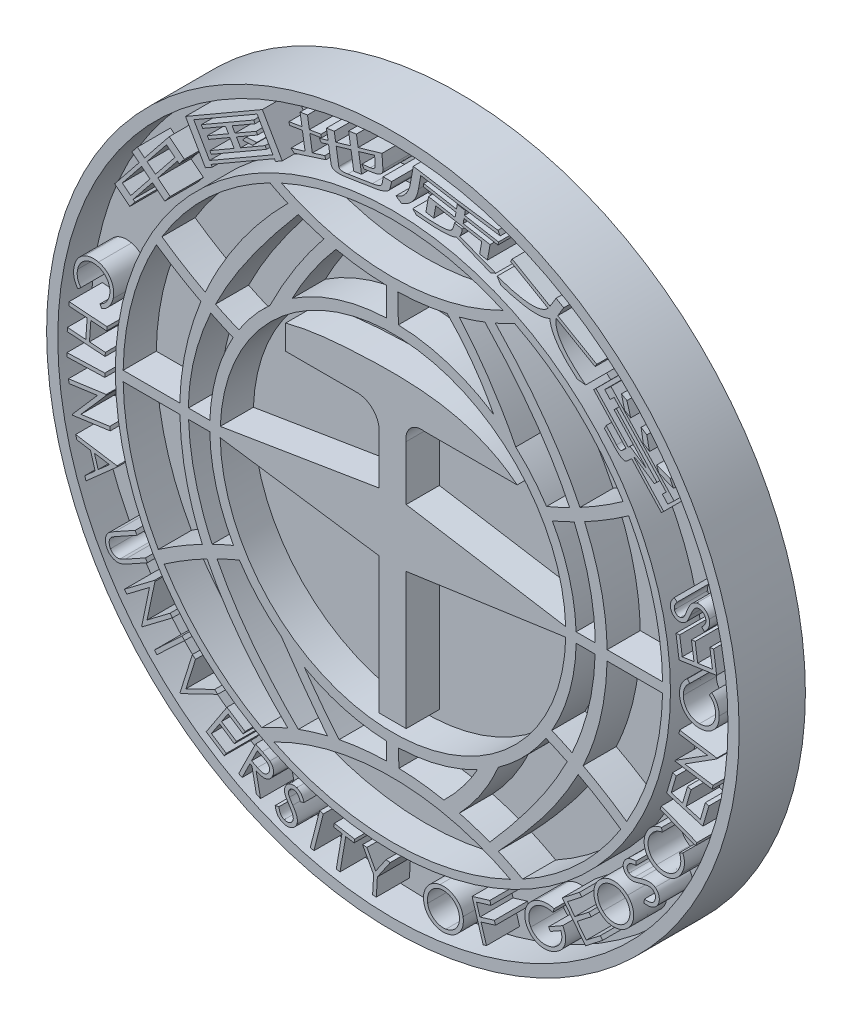
from build123d import *

# Parameters (mm, degrees)
SKETCH_1_R         = 167.658288802
EXTRUDE_2_DEPTH    = 20
SKETCH_1_R_2       = 209.14758283
SKETCH_1_R_3       = 202.402709225
EXTRUDE_2_2_DEPTH  = 20
EXTRUDE_3_DEPTH    = 20
EXTRUDE_3_2_DEPTH  = 20
EXTRUDE_3_3_DEPTH  = 20
EXTRUDE_3_4_DEPTH  = 20
EXTRUDE_3_5_DEPTH  = 20
EXTRUDE_3_6_DEPTH  = 20
EXTRUDE_3_7_DEPTH  = 20
EXTRUDE_3_8_DEPTH  = 20
EXTRUDE_3_9_DEPTH  = 20
EXTRUDE_3_10_DEPTH = 20
EXTRUDE_3_11_DEPTH = 20
EXTRUDE_3_12_DEPTH = 20
EXTRUDE_3_13_DEPTH = 20
EXTRUDE_3_14_DEPTH = 20
EXTRUDE_3_15_DEPTH = 20
EXTRUDE_4_DEPTH    = 20
EXTRUDE_4_2_DEPTH  = 20
EXTRUDE_4_3_DEPTH  = 20
EXTRUDE_4_4_DEPTH  = 20
EXTRUDE_4_5_DEPTH  = 20
EXTRUDE_4_6_DEPTH  = 20
EXTRUDE_4_7_DEPTH  = 20
EXTRUDE_4_8_DEPTH  = 20
EXTRUDE_4_9_DEPTH  = 20
EXTRUDE_4_10_DEPTH = 20
EXTRUDE_4_11_DEPTH = 20
EXTRUDE_4_12_DEPTH = 20
EXTRUDE_4_13_DEPTH = 20
EXTRUDE_4_14_DEPTH = 20
EXTRUDE_4_15_DEPTH = 20
EXTRUDE_4_16_DEPTH = 20
EXTRUDE_4_17_DEPTH = 20
EXTRUDE_4_18_DEPTH = 20
EXTRUDE_4_19_DEPTH = 20
EXTRUDE_4_20_DEPTH = 20
EXTRUDE_4_21_DEPTH = 20
EXTRUDE_4_22_DEPTH = 20
EXTRUDE_4_23_DEPTH = 20
EXTRUDE_4_24_DEPTH = 20
EXTRUDE_4_25_DEPTH = 20
EXTRUDE_4_26_DEPTH = 20
EXTRUDE_4_27_DEPTH = 20
EXTRUDE_4_28_DEPTH = 20
SKETCH_1_7_R       = 209.14758283
EXTRUDE_5_DEPTH    = 20


with BuildPart() as part:
    # 草图1 → 凸台-拉伸2 (new body)
    with BuildSketch(Plane.XY):
        with Locations((215.049044515, 215.886575373)):
            Circle(SKETCH_1_R)
        with BuildLine():
            Line((52.148568831, 218.546644503), (86.421620594, 218.546644503))
            add(Edge.make_bspline(
                [(99.092003439, 278.003157861), (92.756478801, 262.321078582), (87.599405419, 242.46429816), (86.493002449, 222.080526019), (86.421620594, 218.546644503)],
                knots=[0.30200735, 0.30200735, 0.30200735, 0.30200735, 0.46387324, 0.497750256, 0.497750256, 0.497750256, 0.497750256], degree=3))
            ThreePointArc((99.092003439, 278.003157861), (85.408632234, 285.72957407), (72.24136241, 294.306004582))
            ThreePointArc((72.24136241, 294.306004582), (57.571301343, 257.652606441), (52.148568831, 218.546644503))
        make_face(mode=Mode.SUBTRACT)
        with BuildLine():
            Line((52.159952558, 212.602573699), (86.414531228, 212.602573699))
            add(Edge.make_bspline(
                [(86.414531228, 212.602573699), (86.716099494, 195.619527086), (90.498724525, 174.563603505), (98.295952076, 155.131701479), (99.9338364, 151.447779436)],
                knots=[0.516731377, 0.516731377, 0.516731377, 0.516731377, 0.679363181, 0.718188358, 0.718188358, 0.718188358, 0.718188358], degree=3))
            ThreePointArc((99.9338364, 151.447779436), (86.402014607, 143.861526972), (73.371840373, 135.442739237))
            ThreePointArc((73.371840373, 135.442739237), (57.954909699, 172.70007572), (52.159952558, 212.602573699))
        make_face(mode=Mode.SUBTRACT)
        with BuildLine():
            Line((325.707381729, 218.546644503), (337.240043448, 218.546644503))
            add(Edge.make_bspline(
                [(324.543123688, 275.490662045), (329.859665278, 263.163175001), (335.592434984, 244.385692317), (337.152838331, 224.776830547), (337.240043448, 218.546644503)],
                knots=[0.308394887, 0.308394887, 0.308394887, 0.308394887, 0.438917673, 0.499455477, 0.499455477, 0.499455477, 0.499455477], degree=3))
            ThreePointArc((324.543123688, 275.490662045), (317.991860019, 272.362531284), (311.351951891, 269.427249738))
            ThreePointArc((311.351951891, 269.427249738), (321.612441403, 244.856719683), (325.707381729, 218.546644503))
        make_face(mode=Mode.SUBTRACT)
        with BuildLine():
            Line((325.74872571, 212.602573699), (337.200146666, 212.602573699))
            add(Edge.make_bspline(
                [(337.200146666, 212.602573699), (336.867429162, 200.435969177), (333.754054058, 180.199262846), (326.619128886, 161.373121346), (323.264463296, 154.063741419)],
                knots=[0.518698155, 0.518698155, 0.518698155, 0.518698155, 0.63684039, 0.71545079, 0.71545079, 0.71545079, 0.71545079], degree=3))
            ThreePointArc((323.264463296, 154.063741419), (317.194579853, 156.940914729), (311.048880053, 159.652369177))
            ThreePointArc((311.048880053, 159.652369177), (321.73755679, 185.200578566), (325.74872571, 212.602573699))
        make_face(mode=Mode.SUBTRACT)
        with BuildLine():
            Line((110.806386839, 218.546644504), (206.568668641, 234.253923969))
            Line((206.568668641, 234.253923969), (206.568668641, 266.751600528))
            ThreePointArc((206.568668641, 266.751600528), (202.174125349, 274.287625175), (194.089613845, 277.565483008))
            Line((194.089613845, 277.565483008), (150.295224832, 277.565483008))
            Line((150.295224832, 277.565483008), (150.295224832, 292.339763241))
            add(Edge.make_bspline(
                [(150.295224832, 292.339763241), (165.888837697, 296.446075047), (192.067357714, 298.524787761), (240.19038382, 299.437045242), (272.533642435, 291.883944628), (290.096783597, 277.565483008)],
                knots=[0, 0, 0, 0, 0.332839534, 0.543657886, 1, 1, 1, 1], degree=3))
            Line((290.096783597, 277.565483008), (233.912165202, 277.565483008))
            ThreePointArc((233.912165202, 277.565483008), (225.673016645, 274.990749084), (223.098282721, 266.751600528))
            Line((223.098282721, 266.751600528), (223.098282721, 233.794915246))
            Line((223.098282721, 233.794915246), (319.407591614, 218.085101661))
            ThreePointArc((319.407591614, 218.085101661), (215.330123609, 319.164801518), (110.806386839, 218.546644504))
        make_face(mode=Mode.SUBTRACT)
        with BuildLine():
            Line((110.762540345, 212.602573699), (206.568668641, 198.843851527))
            Line((206.568668641, 198.843851527), (206.568668641, 116.61052651))
            Line((206.568668641, 116.61052651), (223.098282721, 116.61052651))
            Line((223.098282721, 116.61052651), (223.098282721, 198.843851527))
            Line((223.098282721, 198.843851527), (319.435902645, 212.602573699))
            ThreePointArc((319.435902645, 212.602573699), (215.099221495, 110.445203673), (110.762540345, 212.602573699))
        make_face(mode=Mode.SUBTRACT)
        with BuildLine():
            Line((211.165325837, 342.479312397), (211.165325837, 325.406615405))
            ThreePointArc((211.165325837, 325.406615405), (181.488428727, 320.249327161), (154.301341904, 307.280975141))
            add(Edge.make_bspline(
                [(180.665834135, 346.12448469), (165.243956381, 328.187974942), (154.301341904, 307.280975141)],
                knots=[0, 0, 0, 1, 1, 1], degree=2))
            ThreePointArc((180.665834135, 346.12448469), (195.825375033, 343.547145412), (211.165325837, 342.479312397))
        make_face(mode=Mode.SUBTRACT)
        with BuildLine():
            Line((217.977848192, 342.491951026), (218.383318033, 325.427816727))
            ThreePointArc((218.383318033, 325.427816727), (248.400150627, 320.347596451), (275.897101086, 307.280975141))
            add(Edge.make_bspline(
                [(247.900374545, 346.12448469), (264.867465176, 328.774363861), (275.897101086, 307.280975141)],
                knots=[0, 0, 0, 1, 1, 1], degree=2))
            ThreePointArc((247.900374545, 346.12448469), (233.027314738, 343.581654005), (217.977848192, 342.491951026))
        make_face(mode=Mode.SUBTRACT)
        with BuildLine():
            Line((211.165325837, 104.203645228), (211.165325837, 93.686164168))
            ThreePointArc((211.165325837, 93.686164168), (196.792279746, 92.777305211), (182.556836342, 90.594960226))
            add(Edge.make_bspline(
                [(182.556836342, 90.594960226), (171.495001056, 103.792605329), (161.630218608, 117.907092313)],
                knots=[0, 0, 0, 1, 1, 1], degree=2))
            ThreePointArc((161.630218608, 117.907092313), (185.591268231, 108.140024809), (211.165325837, 104.203645228))
        make_face(mode=Mode.SUBTRACT)
        with BuildLine():
            Line((218.383318033, 104.182443906), (218.695951375, 93.651590194))
            ThreePointArc((218.695951375, 93.651590194), (232.321501958, 92.695746253), (245.818018708, 90.594960226))
            add(Edge.make_bspline(
                [(245.818018708, 90.594960226), (257.809831349, 102.175616121), (266.148059111, 116.61052651)],
                knots=[0, 0, 0, 1, 1, 1], degree=2))
            ThreePointArc((266.148059111, 116.61052651), (242.967325893, 107.699888633), (218.383318033, 104.182443906))
        make_face(mode=Mode.SUBTRACT)
        with BuildLine():
            Line((91.586664509, 218.546644503), (104.491061261, 218.546644503))
            ThreePointArc((104.491061261, 218.546644503), (108.499836266, 244.549627412), (118.53325313, 268.87155051))
            ThreePointArc((118.53325313, 268.87155051), (111.758712095, 271.821886843), (105.074953426, 274.972483734))
            add(Edge.make_bspline(
                [(105.074953426, 274.972483734), (98.420504808, 260.270363243), (92.677500261, 241.527739873), (91.629855184, 222.08609465), (91.586664509, 218.546644503)],
                knots=[0.306887305, 0.306887305, 0.306887305, 0.306887305, 0.462923811, 0.497524166, 0.497524166, 0.497524166, 0.497524166], degree=3))
        make_face(mode=Mode.SUBTRACT)
        with BuildLine():
            Line((91.650661715, 212.602573699), (104.44971728, 212.602573699))
            ThreePointArc((104.44971728, 212.602573699), (108.366063163, 185.544287006), (118.796187236, 160.271749428))
            ThreePointArc((118.796187236, 160.271749428), (112.284964946, 157.443040205), (105.857515946, 154.428822078))
            add(Edge.make_bspline(
                [(91.650661715, 212.602573699), (92.194748144, 196.341491293), (96.546886703, 176.251249171), (104.303615869, 157.810921011), (105.857515946, 154.428822078)],
                knots=[0.516867087, 0.516867087, 0.516867087, 0.516867087, 0.675458572, 0.711799097, 0.711799097, 0.711799097, 0.711799097], degree=3))
        make_face(mode=Mode.SUBTRACT)
        with BuildLine():
            Line((344.443110809, 218.546644503), (377.949520198, 218.546644503))
            ThreePointArc((377.949520198, 218.546644503), (372.412806371, 258.080027475), (357.42878231, 295.080332773))
            ThreePointArc((357.42878231, 295.080332773), (344.386910017, 286.480875596), (330.830113359, 278.718507336))
            add(Edge.make_bspline(
                [(330.830113359, 278.718507336), (336.090602465, 266.726038555), (342.382072434, 246.976614666), (344.310592726, 226.214529599), (344.443110809, 218.546644503)],
                knots=[0.30088405, 0.30088405, 0.30088405, 0.30088405, 0.425898072, 0.498686863, 0.498686863, 0.498686863, 0.498686863], degree=3))
        make_face(mode=Mode.SUBTRACT)
        with BuildLine():
            Line((344.430544424, 212.602573699), (377.938136472, 212.602573699))
            ThreePointArc((377.938136472, 212.602573699), (372.011480738, 172.223838851), (356.235704106, 134.584865064))
            ThreePointArc((356.235704106, 134.584865064), (343.345271642, 143.028485918), (329.954553012, 150.653880123))
            add(Edge.make_bspline(
                [(344.430544424, 212.602573699), (344.080738637, 196.29751408), (340.217225523, 174.865007969), (332.105338203, 155.249924726), (329.954553012, 150.653880123)],
                knots=[0.517483671, 0.517483671, 0.517483671, 0.517483671, 0.672120881, 0.72077994, 0.72077994, 0.72077994, 0.72077994], degree=3))
        make_face(mode=Mode.SUBTRACT)
        with BuildLine():
            ThreePointArc((147.709358722, 364.240906833), (214.688738862, 348.588239465), (281.582133231, 364.604392233))
            ThreePointArc((281.582133231, 364.604392233), (214.606687058, 378.808167759), (147.709358722, 364.240906833))
        make_face(mode=Mode.SUBTRACT)
        with BuildLine():
            ThreePointArc((140.795161852, 360.903822124), (146.167754751, 358.156433467), (151.642873889, 355.619512242))
            add(Edge.make_bspline(
                [(151.642873889, 355.619512242), (131.475367029, 335.482662277), (113.613892474, 311.007238669), (101.702622691, 284.162778389)],
                knots=[0, 0, 0, 0, 0.280679502, 0.280679502, 0.280679502, 0.280679502], degree=3))
            ThreePointArc((101.702622691, 284.162778389), (88.39000827, 291.720047624), (75.58260768, 300.105064687))
            ThreePointArc((75.58260768, 300.105064687), (103.949017657, 335.052111404), (140.795161852, 360.903822124))
        make_face(mode=Mode.SUBTRACT)
        with BuildLine():
            ThreePointArc((143.200910185, 69.662478388), (214.65773971, 86.863004685), (286.008923613, 69.229367899))
            ThreePointArc((286.008923613, 69.229367899), (214.554933684, 52.965131725), (143.200910185, 69.662478388))
        make_face(mode=Mode.SUBTRACT)
        with BuildLine():
            ThreePointArc((135.855379161, 73.506786381), (143.645595684, 77.541144261), (151.642873889, 81.147674212))
            add(Edge.make_bspline(
                [(102.83776316, 145.260574545), (114.793654585, 121.066097291), (132.453572532, 99.623913994), (151.642873889, 81.147674212)],
                knots=[0.740130074, 0.740130074, 0.740130074, 0.740130074, 1, 1, 1, 1], degree=3))
            ThreePointArc((102.83776316, 145.260574545), (89.609321886, 137.820944987), (76.875891304, 129.562646608))
            ThreePointArc((76.875891304, 129.562646608), (102.809798617, 97.793423048), (135.855379161, 73.506786381))
        make_face(mode=Mode.SUBTRACT)
        with BuildLine():
            ThreePointArc((307.848517037, 275.185029416), (314.870691367, 278.265978047), (321.791573559, 281.568184351))
            add(Edge.make_bspline(
                [(270.622466364, 353.010489763), (290.133528015, 332.496217115), (309.124269869, 308.284891723), (321.791573559, 281.568184351)],
                knots=[0, 0, 0, 0, 0.286798567, 0.286798567, 0.286798567, 0.286798567], degree=3))
            ThreePointArc((270.622466364, 353.010489763), (262.967932452, 350.263905731), (255.180302905, 347.921163895))
            add(Edge.make_bspline(
                [(255.180302905, 347.921163895), (268.254228169, 332.731945654), (279.661719352, 315.784291178), (289.000625895, 297.446950435), (289.241672976, 296.969970286)],
                knots=[0, 0, 0, 0, 1, 1.02665224, 1.02665224, 1.02665224, 1.02665224], degree=3))
            ThreePointArc((289.241672976, 296.969970286), (299.253007615, 286.682138605), (307.848517037, 275.185029416))
        make_face(mode=Mode.SUBTRACT)
        with BuildLine():
            ThreePointArc((307.420082477, 153.772166549), (313.903022069, 150.93656814), (320.299835112, 147.911686821))
            add(Edge.make_bspline(
                [(320.299835112, 147.911686821), (308.191172948, 123.918776411), (290.905401241, 102.250693327), (273.569320028, 82.433032677)],
                knots=[0.737687092, 0.737687092, 0.737687092, 0.737687092, 1, 1, 1, 1], degree=3))
            ThreePointArc((273.569320028, 82.433032677), (264.464591779, 85.711181338), (255.180302905, 88.439608584))
            add(Edge.make_bspline(
                [(255.180302905, 88.439608584), (270.184585542, 104.192196386), (278.722105698, 124.249663091)],
                knots=[0, 0, 0, 1, 1, 1], degree=2))
            ThreePointArc((278.722105698, 124.249663091), (294.456057799, 137.664631417), (307.420082477, 153.772166549))
        make_face(mode=Mode.SUBTRACT)
        with BuildLine():
            ThreePointArc((354.056095835, 300.861163509), (325.500332161, 335.653657674), (288.514349432, 361.304902688))
            ThreePointArc((288.514349432, 361.304902688), (282.777856843, 358.341891961), (276.923334791, 355.619512242))
            add(Edge.make_bspline(
                [(276.923334791, 355.619512242), (296.576911316, 335.163633333), (315.32692825, 311.235786494), (328.040650112, 284.78667059)],
                knots=[0, 0, 0, 0, 0.279649799, 0.279649799, 0.279649799, 0.279649799], degree=3))
            ThreePointArc((328.040650112, 284.78667059), (341.302908553, 292.411968966), (354.056095835, 300.861163509))
        make_face(mode=Mode.SUBTRACT)
        with BuildLine():
            ThreePointArc((293.377637457, 73.029050288), (326.569922568, 97.114799668), (352.69605148, 128.726134695))
            ThreePointArc((352.69605148, 128.726134695), (340.063919798, 137.030263094), (326.935549573, 144.525274405))
            add(Edge.make_bspline(
                [(326.935549573, 144.525274405), (314.60213853, 120.678034454), (296.844706879, 99.529761576), (278.722105698, 80.298631791)],
                knots=[0.742617176, 0.742617176, 0.742617176, 0.742617176, 1, 1, 1, 1], degree=3))
            ThreePointArc((278.722105698, 80.298631791), (286.141736423, 76.849041269), (293.377637457, 73.029050288))
        make_face(mode=Mode.SUBTRACT)
        with BuildLine():
            ThreePointArc((122.387021394, 154.368287322), (133.888434024, 139.618881327), (147.709358722, 127.01691679))
            add(Edge.make_bspline(
                [(147.709358722, 127.01691679), (160.917521812, 107.521033672), (175.475934247, 89.018923466)],
                knots=[0, 0, 0, 1, 1, 1], degree=2))
            ThreePointArc((175.475934247, 89.018923466), (166.633515126, 86.574192729), (157.943742316, 83.632605945))
            add(Edge.make_bspline(
                [(108.829687983, 148.280582354), (121.139255041, 124.02293634), (138.880873952, 102.692149405), (157.943742316, 83.632605945)],
                knots=[0.734042698, 0.734042698, 0.734042698, 0.734042698, 1, 1, 1, 1], degree=3))
            ThreePointArc((108.829687983, 148.280582354), (115.561372959, 151.429063261), (122.387021394, 154.368287322))
        make_face(mode=Mode.SUBTRACT)
        with BuildLine():
            ThreePointArc((107.927153508, 280.999467868), (114.91456098, 277.711977967), (122.003442475, 274.649428019))
            ThreePointArc((122.003442475, 274.649428019), (130.668168148, 286.356239808), (140.795161852, 296.823852322))
            add(Edge.make_bspline(
                [(173.385905775, 347.921163895), (154.27443563, 324.150131291), (140.795161852, 296.823852322)],
                knots=[0, 0, 0, 1, 1, 1], degree=2))
            ThreePointArc((173.385905775, 347.921163895), (165.598276228, 350.263905731), (157.943742316, 353.010489763))
            add(Edge.make_bspline(
                [(157.943742316, 353.010489763), (140.145632479, 331.918159265), (121.041556738, 307.566723317), (107.927153508, 280.999467868)],
                knots=[0, 0, 0, 0, 0.285435755, 0.285435755, 0.285435755, 0.285435755], degree=3))
        make_face(mode=Mode.SUBTRACT)
    extrude(amount=EXTRUDE_2_DEPTH)



with BuildPart() as body_2:
    # 草图1 → Extrude 2 2 (new body)
    with BuildSketch(Plane.XY):
        with Locations((215.049044515, 215.886575373)):
            Circle(SKETCH_1_R_2)
        with Locations((215.049044515, 215.886575373)):
            Circle(SKETCH_1_R_3, mode=Mode.SUBTRACT)
    extrude(amount=EXTRUDE_2_2_DEPTH)


with BuildPart() as body_3:
    # 草图2 → 凸台-拉伸3 (new body)
    with BuildSketch(Plane.XY):
        with BuildLine():
            Line((188.314224948, 411.813164316), (193.03140137, 412.560621992))
            Line((193.03140137, 412.560621992), (194.073275594, 405.995245454))
            Line((194.073275594, 405.995245454), (208.473077496, 410.190240192))
            add(Edge.make_bspline(
                [(208.473077496, 410.190240192), (208.537015254, 409.383671489), (208.637578454, 408.203394514), (208.750396808, 406.667939939), (208.828870827, 405.602960067), (208.896314724, 404.594307238), (208.971574908, 403.363283521), (209.013958119, 402.468331626), (209.041805022, 401.891536338)],
                knots=[0, 0, 0, 0, 0.291790933, 0.427178314, 0.55522742, 0.676899247, 0.791742777, 1, 1, 1, 1], degree=3))
            add(Edge.make_bspline(
                [(209.041805022, 401.891536338), (209.056015712, 401.613293452), (209.035833638, 401.19732166), (208.894757073, 400.668845439), (208.746628825, 400.295774189), (208.538223154, 399.947820893), (208.292087253, 399.612883797), (207.986173747, 399.304204883), (207.633817677, 399.013951878), (207.234294168, 398.739042852), (206.781780412, 398.49183617), (206.282778455, 398.259242189), (205.733537834, 398.04634705), (205.135150291, 397.851388653), (204.241873903, 397.613211532), (203.539342273, 397.483277505), (203.056251204, 397.399399282)],
                knots=[0, 0, 0, 0, 0.101587311, 0.150006108, 0.198636477, 0.247194222, 0.297254946, 0.349618959, 0.404917206, 0.463286329, 0.525883059, 0.592405649, 0.663604379, 0.740192643, 0.821422651, 1, 1, 1, 1], degree=3))
            add(Edge.make_bspline(
                [(203.056251204, 397.399399282), (200.339911771, 396.945184176), (197.616035751, 396.538616702)],
                knots=[0, 0, 0, 1, 1, 1], degree=2))
            add(Edge.make_bspline(
                [(197.616035751, 396.538616702), (197.431355333, 396.851710268), (197.035096828, 397.516754793), (196.602915736, 398.159069907), (196.376121218, 398.500958511)],
                knots=[0, 0, 0, 0, 0.469769734, 1, 1, 1, 1], degree=3))
            add(Edge.make_bspline(
                [(196.376121218, 398.500958511), (197.284962008, 398.596000845), (198.968730843, 398.786220258), (200.646054622, 399.026596926), (201.417102341, 399.147391635)],
                knots=[0, 0, 0, 0, 0.539358553, 1, 1, 1, 1], degree=3))
            add(Edge.make_bspline(
                [(201.417102341, 399.147391635), (201.664354352, 399.179888364), (202.019199815, 399.255158879), (202.474076297, 399.369868574), (202.777688746, 399.468870716), (203.052629786, 399.587063803), (203.306827802, 399.705121465), (203.53100539, 399.844155105), (203.730804435, 399.989894219), (203.901435022, 400.151296476), (204.052509535, 400.318963173), (204.168944192, 400.504962413), (204.266137345, 400.698208014), (204.333923254, 400.906175396), (204.389336301, 401.205428576), (204.395142668, 401.43849473), (204.375995881, 401.59452119)],
                knots=[0, 0, 0, 0, 0.174079809, 0.253334333, 0.327784419, 0.396921382, 0.462405241, 0.523402721, 0.580970291, 0.634897517, 0.68730536, 0.738187174, 0.787726969, 0.838173222, 0.890438008, 1, 1, 1, 1], degree=3))
            add(Edge.make_bspline(
                [(204.375995881, 401.59452119), (204.376803991, 402.434728919), (204.298342392, 404.216553086), (204.09843331, 405.988700002), (203.968846399, 406.922002112)],
                knots=[0, 0, 0, 0, 0.471313194, 1, 1, 1, 1], degree=3))
            Line((203.968846399, 406.922002112), (194.374634615, 404.086346487))
            Line((194.374634615, 404.086346487), (196.124014026, 393.07151546))
            Line((196.124014026, 393.07151546), (191.406837604, 392.324057784))
            Line((191.406837604, 392.324057784), (189.754483044, 402.729075278))
            Line((189.754483044, 402.729075278), (180.810990177, 400.086764258))
            Line((180.810990177, 400.086764258), (182.371925561, 390.238365252))
            add(Edge.make_bspline(
                [(182.371925561, 390.238365252), (182.395972579, 390.080364119), (182.471795725, 389.848859634), (182.657334016, 389.587397349), (182.829970343, 389.413248864), (183.042105524, 389.263869973), (183.293070632, 389.138768194), (183.578686679, 389.030669932), (183.903644442, 388.951316662), (184.263267461, 388.885815407), (184.662980469, 388.8524228), (185.098775291, 388.83267658), (185.572356166, 388.836639726), (186.083071193, 388.862473215), (186.841245703, 388.92904163), (187.426634805, 389.009578423), (187.828462447, 389.073663025)],
                knots=[0, 0, 0, 0, 0.078917625, 0.117596896, 0.15721848, 0.199304175, 0.244912043, 0.295194003, 0.349581753, 0.409634927, 0.475295076, 0.54718669, 0.624740311, 0.708739003, 0.799317878, 1, 1, 1, 1], degree=3))
            Line((187.828462447, 389.073663025), (202.642331892, 391.422418485))
            add(Edge.make_bspline(
                [(202.642331892, 391.422418485), (203.080678361, 391.489020632), (203.716378697, 391.603533093), (204.531127483, 391.787684959), (205.084746244, 391.921674865), (205.596253915, 392.071914709), (206.067172027, 392.227865981), (206.496507881, 392.393018586), (206.884397772, 392.566317379), (207.233998842, 392.746329843), (207.538548379, 392.940703436), (207.806906262, 393.137652181), (208.028121944, 393.348933004), (208.21594693, 393.563927107), (208.402347619, 393.863245634), (208.490685388, 394.108282179), (208.513326447, 394.276078109)],
                knots=[0, 0, 0, 0, 0.193900564, 0.282315224, 0.365275246, 0.442942086, 0.515378459, 0.582164499, 0.64400812, 0.701108821, 0.75392791, 0.801877492, 0.846406524, 0.887448046, 0.926386622, 1, 1, 1, 1], degree=3))
            add(Edge.make_bspline(
                [(208.513326447, 394.276078109), (208.680984106, 394.890470022), (208.942227158, 396.210959098), (209.078571037, 397.549667458), (209.12432695, 398.255905324)],
                knots=[0, 0, 0, 0, 0.473491459, 1, 1, 1, 1], degree=3))
            add(Edge.make_bspline(
                [(209.12432695, 398.255905324), (211.692145621, 398.237815169), (214.258990933, 398.311284432)],
                knots=[0, 0, 0, 1, 1, 1], degree=2))
            add(Edge.make_bspline(
                [(214.258990933, 398.311284432), (214.120707334, 397.527357795), (213.831954646, 396.108579803), (213.458814648, 394.709255871), (213.25343489, 394.090844436)],
                knots=[0, 0, 0, 0, 0.549992406, 1, 1, 1, 1], degree=3))
            add(Edge.make_bspline(
                [(213.25343489, 394.090844436), (213.16773406, 393.825655008), (212.9818461, 393.438725923), (212.636464254, 392.969596137), (212.313603461, 392.630425485), (211.939636706, 392.304554836), (211.513142479, 391.991250407), (211.028100831, 391.697881363), (210.488514996, 391.416381007), (209.893276217, 391.149688955), (209.245345338, 390.894413633), (208.541552431, 390.658794055), (207.783433149, 390.435097283), (206.969874625, 390.225717397), (205.779490679, 389.954346543), (204.852504982, 389.792786066), (204.216771511, 389.689995078)],
                knots=[0, 0, 0, 0, 0.079707476, 0.121905006, 0.166358159, 0.213522405, 0.263792721, 0.317699727, 0.375684542, 0.437973494, 0.504392489, 0.575028882, 0.650431504, 0.730699878, 0.815553113, 1, 1, 1, 1], degree=3))
            Line((204.216771511, 389.689995078), (186.981739052, 386.960234108))
            add(Edge.make_bspline(
                [(186.981739052, 386.960234108), (186.300752826, 386.85506999), (185.310216151, 386.713921533), (184.024550025, 386.61696174), (183.158192831, 386.573203497), (182.354434396, 386.579628027), (181.613958768, 386.613797708), (180.937351199, 386.693770756), (180.324091281, 386.811979212), (179.774105569, 386.968497377), (179.285976945, 387.163697163), (178.860174088, 387.39853581), (178.496086957, 387.671641471), (178.199344522, 387.988509158), (177.884934474, 388.467858413), (177.754324587, 388.883200148), (177.708479509, 389.167575492)],
                knots=[0, 0, 0, 0, 0.197962182, 0.287044286, 0.370216391, 0.446995633, 0.517790069, 0.582994591, 0.642477829, 0.696971432, 0.746972798, 0.793124799, 0.836242831, 0.877123615, 0.917170597, 1, 1, 1, 1], degree=3))
            Line((177.708479509, 389.167575492), (176.192175404, 398.721989242))
            Line((176.192175404, 398.721989242), (171.752525103, 397.416229077))
            Line((171.752525103, 397.416229077), (170.669023485, 399.174177042))
            Line((170.669023485, 399.174177042), (175.880122007, 400.690918663))
            Line((175.880122007, 400.690918663), (174.939283026, 406.623970247))
            Line((174.939283026, 406.623970247), (179.657127846, 407.36767602))
            Line((179.657127846, 407.36767602), (180.503615569, 402.029430355))
            Line((180.503615569, 402.029430355), (189.453124024, 404.637974245))
            Line((189.453124024, 404.637974245), (188.314224948, 411.813164316))
        make_face()
    extrude(amount=EXTRUDE_3_DEPTH)


with BuildPart() as body_4:
    # 草图2 → Extrude 3 2 (new body)
    with BuildSketch(Plane.XY):
        with BuildLine():
            Line((162.016421518, 388.032697659), (160.411523254, 398.171330017))
            Line((160.411523254, 398.171330017), (152.610843638, 396.936484399))
            Line((152.610843638, 396.936484399), (152.329126663, 398.713398352))
            Line((152.329126663, 398.713398352), (160.129806278, 399.94824397))
            Line((160.129806278, 399.94824397), (159.005611971, 407.040892168))
            Line((159.005611971, 407.040892168), (163.481329783, 407.753076145))
            Line((163.481329783, 407.753076145), (164.605524091, 400.660427947))
            Line((164.605524091, 400.660427947), (171.619382319, 401.770585885))
            Line((171.619382319, 401.770585885), (171.901099294, 399.993671933))
            Line((171.901099294, 399.993671933), (164.887241066, 398.883513994))
            Line((164.887241066, 398.883513994), (166.394855991, 389.377874988))
            add(Edge.make_bspline(
                [(166.394855991, 389.377874988), (170.173921435, 390.55885505), (173.951071517, 391.74594683)],
                knots=[0, 0, 0, 1, 1, 1], degree=2))
            add(Edge.make_bspline(
                [(173.951071517, 391.74594683), (174.045051941, 391.416092522), (174.248322667, 390.79593814), (174.52530992, 390.204837065), (174.676137125, 389.935756715)],
                knots=[0, 0, 0, 0, 0.526664514, 1, 1, 1, 1], degree=3))
            add(Edge.make_bspline(
                [(174.676137125, 389.935756715), (165.075895141, 386.894577221), (155.501982405, 383.771502267)],
                knots=[0, 0, 0, 1, 1, 1], degree=2))
            Line((155.501982405, 383.771502267), (153.498230522, 385.458411866))
            add(Edge.make_bspline(
                [(153.498230522, 385.458411866), (157.759708477, 386.73767124), (162.016421518, 388.032697659)],
                knots=[0, 0, 0, 1, 1, 1], degree=2))
        make_face()
    extrude(amount=EXTRUDE_3_2_DEPTH)


with BuildPart() as body_5:
    # 草图2 → Extrude 3 3 (new body)
    with BuildSketch(Plane.XY):
        with BuildLine():
            Line((308.777869221, 379.372520966), (286.067467408, 392.484164635))
            Line((286.067467408, 392.484164635), (287.073758093, 394.227569314))
            Line((287.073758093, 394.227569314), (309.972692432, 381.006488479))
            add(Edge.make_bspline(
                [(309.972692432, 381.006488479), (311.853421266, 383.956196173), (313.601468973, 386.986424566)],
                knots=[0, 0, 0, 1, 1, 1], degree=2))
            Line((313.601468973, 386.986424566), (318.229495402, 384.31325163))
            add(Edge.make_bspline(
                [(318.229495402, 384.31325163), (316.480917259, 381.284600999), (314.599205526, 378.336813164)],
                knots=[0, 0, 0, 1, 1, 1], degree=2))
            Line((314.599205526, 378.336813164), (338.186085159, 364.715785579))
            Line((338.186085159, 364.715785579), (337.179794475, 362.9723809))
            Line((337.179794475, 362.9723809), (313.511697161, 376.637163255))
            add(Edge.make_bspline(
                [(313.511697161, 376.637163255), (313.447799042, 376.171455412), (313.41287255, 375.464226769), (313.428585724, 374.516299567), (313.483069015, 373.793992452), (313.580436479, 373.064874533), (313.714156483, 372.326583626), (313.898312586, 371.584574853), (314.11366791, 370.831745169), (314.373062894, 370.072288294), (314.671962921, 369.305284132), (315.011697621, 368.531068842), (315.391860866, 367.749527193), (315.813079668, 366.959510664), (316.275034369, 366.162329259), (316.776085882, 365.358360386), (317.320460288, 364.549328117), (317.897359841, 363.727340996), (318.523751846, 362.901361087), (319.187260783, 362.065183389), (319.893221005, 361.223102153), (320.639474581, 360.375767812), (321.420776674, 359.516060416), (322.247931468, 358.653816091), (323.116775169, 357.784012656), (324.018777361, 356.899190363), (324.969607883, 356.016387368), (325.954875962, 355.118996341), (326.983613944, 354.217298446), (328.05635037, 353.310747897), (329.548476776, 352.06556776), (330.712552551, 351.157907379), (331.495650119, 350.543068339)],
                knots=[0, 0, 0, 0, 0.042735627, 0.064357574, 0.086260567, 0.108622628, 0.131285175, 0.15451375, 0.178177101, 0.202537516, 0.227529366, 0.253082472, 0.279470028, 0.306615023, 0.334552933, 0.363316298, 0.392821201, 0.423298529, 0.45470735, 0.4871583, 0.520449102, 0.554710621, 0.589922746, 0.626177194, 0.663451102, 0.701820938, 0.741173795, 0.78153625, 0.823119181, 0.865675784, 0.909370237, 1, 1, 1, 1], degree=3))
            add(Edge.make_bspline(
                [(331.495650119, 350.543068339), (330.971935912, 350.615943386), (330.211120844, 350.715479064), (329.229641548, 350.838845978), (328.568121538, 350.908247695), (327.956915426, 350.967764868), (327.242492536, 351.031833019), (326.73036752, 351.056380807), (326.405674876, 351.068889807)],
                knots=[0, 0, 0, 0, 0.309861659, 0.449669728, 0.579682369, 0.699640538, 0.809557295, 1, 1, 1, 1], degree=3))
            add(Edge.make_bspline(
                [(326.405674876, 351.068889807), (325.766321324, 351.594679427), (324.8295318, 352.391155502), (323.610435377, 353.463290405), (322.732171275, 354.253424628), (321.8842053, 355.040789985), (321.068048221, 355.827422372), (320.274832202, 356.602503413), (319.511016074, 357.374618007), (318.781308794, 358.145668949), (318.074996423, 358.90937924), (317.398229521, 359.66840766), (316.751274249, 360.424410174), (316.131980866, 361.173916899), (315.539200859, 361.917736553), (314.97688134, 362.658679742), (314.447464841, 363.398474156), (313.937887751, 364.127970258), (313.46084589, 364.856262768), (313.015549808, 365.580538154), (312.595974184, 366.298848458), (312.203683638, 367.010957899), (311.842806032, 367.721812971), (311.508882639, 368.42612867), (311.201017382, 369.125195515), (310.924481526, 369.820044819), (310.681670496, 370.512273948), (310.457199365, 371.196781452), (310.266168254, 371.878835336), (310.106349825, 372.557281775), (309.928888947, 373.448281557), (309.835956433, 374.118550838), (309.795333895, 374.564114373)],
                knots=[0, 0, 0, 0, 0.08430028, 0.125215606, 0.1653345, 0.204610794, 0.243054322, 0.28077243, 0.317554609, 0.353653813, 0.388882226, 0.423493055, 0.457211787, 0.490212056, 0.522504831, 0.554070814, 0.584928147, 0.615146144, 0.644688894, 0.673578282, 0.701724358, 0.729401812, 0.756363702, 0.782900428, 0.808775159, 0.834143957, 0.859040261, 0.883473431, 0.907496603, 0.931148699, 0.954442852, 1, 1, 1, 1], degree=3))
            add(Edge.make_bspline(
                [(309.795333895, 374.564114373), (309.453341664, 374.372241945), (308.911396146, 374.125061832), (308.162681637, 373.830545448), (307.565072218, 373.636362696), (306.941987123, 373.463972926), (306.294490893, 373.306333368), (305.620387957, 373.178379444), (304.920280457, 373.071646258), (304.194535908, 372.987371676), (303.442165195, 372.917457312), (302.663055228, 372.877291549), (301.857690307, 372.857034148), (301.027338858, 372.858425551), (300.171033378, 372.884984484), (299.288578127, 372.930172097), (298.37994943, 372.997244381), (297.445594026, 373.089745512), (296.484886637, 373.20090168), (295.497047805, 373.332262142), (294.484848408, 373.496484089), (293.444818133, 373.671377281), (292.379698035, 373.870534215), (291.288151161, 374.093618476), (290.171230772, 374.341511929), (289.025456472, 374.602927127), (287.857665514, 374.899711018), (286.660193066, 375.203354661), (285.440506395, 375.544306125), (284.190668501, 375.891844416), (282.474962729, 376.410220463), (281.173424946, 376.803706335), (280.303004678, 377.092655424)],
                knots=[0, 0, 0, 0, 0.038843912, 0.059015021, 0.079762125, 0.101124338, 0.123120181, 0.145830659, 0.169145633, 0.193339539, 0.218278663, 0.244067845, 0.270690381, 0.298167213, 0.326403236, 0.355644101, 0.385791461, 0.416749452, 0.44875182, 0.481700337, 0.515566707, 0.550439753, 0.58628945, 0.623021034, 0.66092265, 0.699751135, 0.739562887, 0.780411982, 0.822260586, 0.865153515, 0.909060157, 1, 1, 1, 1], degree=3))
            add(Edge.make_bspline(
                [(280.303004678, 377.092655424), (280.166756613, 377.3203557), (279.949749482, 377.682307703), (279.637517849, 378.186539772), (279.360851286, 378.619975731), (279.062009612, 379.093224378), (278.607208065, 379.797947399), (278.247865903, 380.342263128), (277.999583768, 380.717647147)],
                knots=[0, 0, 0, 0, 0.185330795, 0.29474528, 0.41420945, 0.544466941, 0.685660047, 1, 1, 1, 1], degree=3))
            add(Edge.make_bspline(
                [(277.999583768, 380.717647147), (278.983103988, 380.363874224), (280.450607165, 379.875556705), (282.386440714, 379.251177262), (283.783624923, 378.821306239), (285.146473207, 378.428063848), (286.473823203, 378.061018229), (287.766157337, 377.725181438), (289.024529902, 377.420751759), (290.248106021, 377.149197987), (291.436156301, 376.901560078), (292.590559033, 376.692536414), (293.708172661, 376.509804719), (294.791858174, 376.358119947), (295.841865365, 376.241312437), (296.857335325, 376.150930527), (297.836620837, 376.09429645), (298.781218353, 376.062352117), (299.690632829, 376.073094227), (300.565956924, 376.104388522), (301.406509151, 376.166896367), (302.211936277, 376.268247258), (302.983256427, 376.390593654), (303.719160856, 376.552783663), (304.421591744, 376.737256654), (305.088374444, 376.959397902), (305.71920745, 377.212441065), (306.319394586, 377.489497289), (306.881166993, 377.804050387), (307.408895934, 378.149122629), (308.06365144, 378.645752162), (308.506940841, 379.070798648), (308.777869221, 379.372520966)],
                knots=[0, 0, 0, 0, 0.097267685, 0.14393588, 0.189306478, 0.233312204, 0.275946413, 0.317475837, 0.357579243, 0.396434221, 0.434121342, 0.470519232, 0.505611601, 0.539513913, 0.572347801, 0.603929384, 0.634384821, 0.663633348, 0.691872311, 0.719009711, 0.745144782, 0.770285102, 0.794543992, 0.817800309, 0.840389512, 0.862107993, 0.883161091, 0.903623283, 0.92358722, 0.943024329, 0.9622652, 1, 1, 1, 1], degree=3))
        make_face()
    extrude(amount=EXTRUDE_3_3_DEPTH)


with BuildPart() as body_6:
    # 草图2 → Extrude 3 4 (new body)
    with BuildSketch(Plane.XY):
        Polygon((236.578466057, 401.634287311), (252.64358889, 398.800917364), (253.162386274, 401.738208021), (233.35418126, 405.231857276), (233.667123113, 407.004321392), (253.475328128, 403.510672137), (253.961375136, 406.270265524), (258.792483802, 405.420246833), (258.306436794, 402.660653446), (278.839992799, 399.040511269), (278.527050945, 397.268047153), (257.993494941, 400.88818933), (257.474697557, 397.950898673), (273.721158138, 395.085905495), (272.151772235, 386.174263456), (267.442017462, 387.006002694), (268.702101989, 394.146307763), (240.977792308, 399.034851581), (239.717707781, 391.894546512), (235.009080154, 392.722645272), align=None)
    extrude(amount=EXTRUDE_3_4_DEPTH)


with BuildPart() as body_7:
    # 草图2 → Extrude 3 5 (new body)
    with BuildSketch(Plane.XY):
        with BuildLine():
            Line((278.511848626, 404.970974557), (279.857661899, 402.698763163))
            add(Edge.make_bspline(
                [(279.857661899, 402.698763163), (276.002158183, 403.255201195), (270.186072975, 404.127346891), (262.384461356, 405.320154711), (256.423320812, 406.252010632), (250.38834237, 407.210868095), (242.195822787, 408.546401752), (236.015955348, 409.569388865), (231.87378367, 410.270978312)],
                knots=[0, 0, 0, 0, 0.240563838, 0.363189265, 0.487389886, 0.613166769, 0.740555853, 1, 1, 1, 1], degree=3))
            Line((231.87378367, 410.270978312), (230.506094742, 402.498938511))
            add(Edge.make_bspline(
                [(230.506094742, 402.498938511), (230.36096664, 401.71803684), (230.11471542, 400.567161207), (229.634315743, 399.100723555), (229.237238862, 398.068741001), (228.784662076, 397.0910959), (228.273587912, 396.169624417), (227.711583994, 395.299479167), (227.098324776, 394.479618682), (226.427211058, 393.717921403), (225.704282385, 393.008512071), (224.928921144, 392.35265377), (224.096800875, 391.751946907), (223.213846221, 391.202968578), (221.94776102, 390.53744211), (220.943040415, 390.127875106), (220.249485699, 389.896248937)],
                knots=[0, 0, 0, 0, 0.139031895, 0.205364547, 0.269736367, 0.332348066, 0.39363681, 0.453892988, 0.513406338, 0.572550202, 0.63128192, 0.690422027, 0.750007508, 0.810638201, 0.872129211, 1, 1, 1, 1], degree=3))
            add(Edge.make_bspline(
                [(220.249485699, 389.896248937), (218.617009173, 391.08702976), (216.917393148, 392.179823767)],
                knots=[0, 0, 0, 1, 1, 1], degree=2))
            add(Edge.make_bspline(
                [(216.917393148, 392.179823767), (217.50130661, 392.358030571), (218.348424473, 392.68598179), (219.413023596, 393.235525507), (220.15919036, 393.694348835), (220.861122769, 394.202722801), (221.518660595, 394.763589526), (222.131199718, 395.377107164), (222.699403208, 396.041105212), (223.227735037, 396.752826643), (223.700302595, 397.522420158), (224.143008833, 398.336156139), (224.529118443, 399.205801261), (224.879179459, 400.122168148), (225.289078638, 401.438924097), (225.51570456, 402.468210493), (225.642235699, 403.171259932)],
                knots=[0, 0, 0, 0, 0.123329181, 0.183046824, 0.241881293, 0.300164968, 0.358003774, 0.416334347, 0.475161537, 0.534460076, 0.595240753, 0.657501091, 0.721517304, 0.787347184, 0.855630686, 1, 1, 1, 1], degree=3))
            Line((225.642235699, 403.171259932), (227.355616857, 412.893461119))
            add(Edge.make_bspline(
                [(227.355616857, 412.893461119), (229.757375791, 412.475750126), (233.331532971, 411.856243875), (238.060039614, 411.05760392), (241.519419616, 410.485509662), (244.91912994, 409.925185044), (248.262305293, 409.385163963), (251.547031874, 408.860619739), (254.7744694, 408.362771336), (257.941688099, 407.872781618), (261.051356504, 407.40420852), (264.102623114, 406.951160157), (267.097477016, 406.523519775), (270.03284583, 406.108150977), (273.829659091, 405.579406754), (276.651089555, 405.21614414), (278.511848626, 404.970974557)],
                knots=[0, 0, 0, 0, 0.141267273, 0.210203999, 0.277889262, 0.344455193, 0.409869186, 0.474131671, 0.537210769, 0.599105436, 0.659849947, 0.719444838, 0.777859096, 0.835156478, 0.891239365, 1, 1, 1, 1], degree=3))
        make_face()
    extrude(amount=EXTRUDE_3_5_DEPTH)


with BuildPart() as body_8:
    # 草图2 → Extrude 3 6 (new body)
    with BuildSketch(Plane.XY):
        with BuildLine():
            Line((277.175082415, 381.817177105), (274.250434492, 380.401011925))
            add(Edge.make_bspline(
                [(274.250434492, 380.401011925), (272.430576316, 381.17218425), (269.722848798, 382.313162676), (266.13555522, 383.792930199), (263.519325878, 384.863890881), (260.947727525, 385.894614644), (257.616853472, 387.215440156), (255.140838998, 388.188336951), (253.499173242, 388.808920598)],
                knots=[0, 0, 0, 0, 0.264817146, 0.393673243, 0.51991664, 0.643573893, 0.764862806, 1, 1, 1, 1], degree=3))
            add(Edge.make_bspline(
                [(253.499173242, 388.808920598), (253.266788715, 388.693393251), (252.894325299, 388.54994418), (252.37975481, 388.366119592), (251.953965881, 388.241214305), (251.503132639, 388.119756229), (251.024012842, 388.013542191), (250.520316178, 387.913285378), (249.990150583, 387.821312488), (249.433657117, 387.737388688), (248.850775147, 387.659516107), (248.240534467, 387.596372751), (247.603832556, 387.536991524), (246.940128052, 387.494400876), (246.250453571, 387.449448498), (245.53390316, 387.421583983), (244.790532767, 387.396908383), (244.020639931, 387.388961733), (243.224176809, 387.379370516), (242.400870323, 387.384294794), (241.552198444, 387.402140422), (240.676640924, 387.421549542), (239.774864973, 387.454147325), (238.845137626, 387.493795501), (237.889633568, 387.538600483), (236.908482492, 387.602888587), (235.900284198, 387.659663843), (234.865962349, 387.744700232), (233.803230356, 387.822164639), (232.715520616, 387.918777205), (231.210684169, 388.047931926), (230.071539195, 388.170967156), (229.301643113, 388.246695462)],
                knots=[0, 0, 0, 0, 0.031857912, 0.049050498, 0.06716956, 0.086397166, 0.106450791, 0.127494574, 0.149541592, 0.172603213, 0.19668937, 0.221838384, 0.248030884, 0.27530882, 0.303607355, 0.333006513, 0.363473359, 0.395055646, 0.427669703, 0.4614092, 0.496280491, 0.532040845, 0.569088561, 0.60722781, 0.646460558, 0.686697162, 0.728122185, 0.77061386, 0.814294596, 0.859135864, 0.90487722, 1, 1, 1, 1], degree=3))
            add(Edge.make_bspline(
                [(229.301643113, 388.246695462), (228.973155251, 388.611517546), (228.23062172, 389.395750055), (227.457349667, 390.149665745), (227.03086165, 390.555669114)],
                knots=[0, 0, 0, 0, 0.454632407, 1, 1, 1, 1], degree=3))
            add(Edge.make_bspline(
                [(227.03086165, 390.555669114), (227.801576378, 390.468338148), (228.943456238, 390.350461044), (230.447190552, 390.199883912), (231.529447399, 390.097163619), (232.582590827, 390.003126629), (233.605433426, 389.917853118), (234.598869986, 389.837681369), (235.561719301, 389.768095152), (236.494531263, 389.712098671), (237.397516351, 389.653281027), (238.270641051, 389.610563128), (239.114096281, 389.575075557), (239.927215765, 389.548627586), (240.711095705, 389.526588969), (241.464720585, 389.517475788), (242.187911377, 389.513877769), (242.880790225, 389.515747234), (243.544496861, 389.529758684), (244.177773453, 389.551566738), (244.782142917, 389.576721977), (245.355724512, 389.614449084), (245.899598606, 389.66542439), (246.414070638, 389.714286635), (246.899113267, 389.776028863), (247.352881253, 389.849882828), (247.777981247, 389.928746442), (248.173324028, 390.013635208), (248.537287449, 390.110945483), (248.872560971, 390.214410459), (249.265353776, 390.353446127), (249.537143121, 390.484275711), (249.703990762, 390.578096241)],
                knots=[0, 0, 0, 0, 0.101815635, 0.150687608, 0.198378938, 0.244518897, 0.289480687, 0.333110716, 0.375348934, 0.41619829, 0.45577884, 0.49413092, 0.530945188, 0.566594447, 0.600923277, 0.633881768, 0.6655253, 0.695856457, 0.724831663, 0.752663417, 0.779034112, 0.804232015, 0.828107397, 0.850737922, 0.872066655, 0.892276804, 0.911078517, 0.928817923, 0.94533993, 0.960514444, 0.974870697, 1, 1, 1, 1], degree=3))
            add(Edge.make_bspline(
                [(249.703990762, 390.578096241), (250.035036382, 390.728051601), (250.488933297, 391.081890943), (250.967212566, 391.714882395), (251.304001399, 392.306044075), (251.594357653, 393.003890751), (251.952159066, 394.129696632), (252.121934545, 395.047581236), (252.222321204, 395.690360955)],
                knots=[0, 0, 0, 0, 0.183422205, 0.286624071, 0.401120869, 0.527831294, 0.669482818, 1, 1, 1, 1], degree=3))
            Line((252.222321204, 395.690360955), (256.930948831, 394.862262195))
            add(Edge.make_bspline(
                [(256.930948831, 394.862262195), (256.859092096, 394.348685362), (256.736744824, 393.607660734), (256.498073401, 392.674702887), (256.31100167, 392.063328952), (256.096830198, 391.515223835), (255.793858162, 390.893349588), (255.522833136, 390.475048395), (255.310325259, 390.239382183)],
                knots=[0, 0, 0, 0, 0.313731784, 0.4533779, 0.582071396, 0.700116044, 0.808797006, 1, 1, 1, 1], degree=3))
            add(Edge.make_bspline(
                [(255.310325259, 390.239382183), (258.921806963, 388.893634731), (266.228723672, 386.134243157), (273.498922957, 383.279493121), (277.175082415, 381.817177105)],
                knots=[0, 0, 0, 0, 0.493453617, 1, 1, 1, 1], degree=3))
        make_face()
    extrude(amount=EXTRUDE_3_6_DEPTH)


with BuildPart() as body_9:
    # 草图2 → Extrude 3 7 (new body)
    with BuildSketch(Plane.XY):
        with BuildLine():
            Line((337.678431643, 351.79564024), (357.232019421, 330.825428805))
            Line((357.232019421, 330.825428805), (358.283535274, 331.805482443))
            Line((358.283535274, 331.805482443), (368.289447602, 325.135554485))
            Line((368.289447602, 325.135554485), (348.650894201, 346.196185994))
            Line((348.650894201, 346.196185994), (350.022090917, 347.475672502))
            Line((350.022090917, 347.475672502), (374.550646563, 321.173514729))
            Line((374.550646563, 321.173514729), (372.974978083, 319.704460867))
            Line((372.974978083, 319.704460867), (361.032009283, 327.578390341))
            Line((361.032009283, 327.578390341), (360.616644556, 327.195149258))
            Line((360.616644556, 327.195149258), (378.583100201, 307.928657804))
            Line((378.583100201, 307.928657804), (377.211903485, 306.649171295))
            Line((377.211903485, 306.649171295), (359.24544784, 325.915662749))
            Line((359.24544784, 325.915662749), (356.412634332, 323.271724109))
            add(Edge.make_bspline(
                [(356.412634332, 323.271724109), (356.237540292, 323.105293967), (355.936143808, 322.904689857), (355.484844867, 322.743255755), (355.126961613, 322.69147274), (354.748981074, 322.693889373), (354.350458592, 322.756434416), (353.930302253, 322.875008036), (353.491360054, 323.054211528), (353.032993172, 323.29172476), (352.54838909, 323.579702196), (352.046020056, 323.93265368), (351.523260519, 324.34214257), (350.977217712, 324.806258122), (350.192273936, 325.527321989), (349.616702895, 326.122955653), (349.225846858, 326.537804033)],
                knots=[0, 0, 0, 0, 0.083501516, 0.123750309, 0.165133495, 0.208108168, 0.254275375, 0.304461789, 0.359055992, 0.418238995, 0.483196109, 0.554229077, 0.630794422, 0.713215995, 0.802469306, 1, 1, 1, 1], degree=3))
            add(Edge.make_bspline(
                [(349.225846858, 326.537804033), (348.74419872, 327.050797398), (348.014085279, 327.842110685), (347.016939916, 328.91730043), (346.226947577, 329.774103472), (345.403526687, 330.661135115), (344.255307623, 331.914820738), (343.375069564, 332.867883815), (342.784290719, 333.519373525)],
                knots=[0, 0, 0, 0, 0.22222414, 0.340028422, 0.463107839, 0.590277726, 0.72225777, 1, 1, 1, 1], degree=3))
            add(Edge.make_bspline(
                [(342.784290719, 333.519373525), (342.979977715, 333.798164837), (343.377679025, 334.458142609), (343.702993729, 335.156369246), (343.881114046, 335.546215931)],
                knots=[0, 0, 0, 0, 0.44257207, 1, 1, 1, 1], degree=3))
            add(Edge.make_bspline(
                [(343.881114046, 335.546215931), (344.918695287, 334.329327047), (346.980549318, 331.978831122), (349.068040983, 329.651058889), (350.105285049, 328.529671267)],
                knots=[0, 0, 0, 0, 0.511457929, 1, 1, 1, 1], degree=3))
            add(Edge.make_bspline(
                [(350.105285049, 328.529671267), (350.424327761, 328.191948503), (350.880350681, 327.722044832), (351.534762835, 327.242904662), (351.955790985, 327.013909311), (352.345287946, 326.881836638), (352.824397845, 326.85782288), (353.149703153, 327.00533619), (353.308901223, 327.163060093)],
                knots=[0, 0, 0, 0, 0.363321288, 0.508399754, 0.631376525, 0.736232295, 0.826716082, 1, 1, 1, 1], degree=3))
            Line((353.308901223, 327.163060093), (355.860822704, 329.545942297))
            Line((355.860822704, 329.545942297), (336.307234927, 350.516153731))
            Line((336.307234927, 350.516153731), (337.678431643, 351.79564024))
        make_face()
    extrude(amount=EXTRUDE_3_7_DEPTH)


with BuildPart() as body_10:
    # 草图2 → Extrude 3 8 (new body)
    with BuildSketch(Plane.XY):
        Polygon((346.75550335, 357.414985823), (384.862989161, 316.549710421), (381.072290476, 313.012736955), (377.772630964, 316.552596428), (380.192132933, 318.810083385), (348.689229934, 352.59448243), (346.269727965, 350.336995473), (342.964804664, 353.878012358), align=None)
    extrude(amount=EXTRUDE_3_8_DEPTH)


with BuildPart() as body_11:
    # 草图2 → Extrude 3 9 (new body)
    with BuildSketch(Plane.XY):
        with BuildLine():
            Line((382.469201457, 327.133130597), (384.48328166, 322.979225903))
            add(Edge.make_bspline(
                [(384.48328166, 322.979225903), (383.069563197, 323.531253134), (380.164992343, 324.704608078), (377.259659105, 325.876035566), (375.767268337, 326.493262436)],
                knots=[0, 0, 0, 0, 0.484465037, 1, 1, 1, 1], degree=3))
            Line((375.767268337, 326.493262436), (374.296094524, 330.067015253))
            add(Edge.make_bspline(
                [(374.296094524, 330.067015253), (375.655893922, 329.498699667), (378.353468252, 328.442156858), (381.106306986, 327.539215797), (382.469201457, 327.133130597)],
                knots=[0, 0, 0, 0, 0.508933931, 1, 1, 1, 1], degree=3))
        make_face()
    extrude(amount=EXTRUDE_3_9_DEPTH)


with BuildPart() as body_12:
    # 草图2 → Extrude 3 10 (new body)
    with BuildSketch(Plane.XY):
        with BuildLine():
            Line((364.963245395, 345.156082076), (368.392140283, 342.906675554))
            add(Edge.make_bspline(
                [(368.392140283, 342.906675554), (368.73212855, 341.564892716), (369.348012121, 338.938072918), (369.841819848, 336.285580594), (370.053347584, 334.98963674)],
                knots=[0, 0, 0, 0, 0.513187631, 1, 1, 1, 1], degree=3))
            Line((370.053347584, 334.98963674), (366.276337552, 337.500449949))
            add(Edge.make_bspline(
                [(366.276337552, 337.500449949), (366.211102524, 338.078163823), (366.093966728, 338.959441136), (365.917408788, 340.153557694), (365.762290863, 341.095241066), (365.589813244, 342.067203488), (365.325540212, 343.42491454), (365.113399454, 344.457898633), (364.963245395, 345.156082076)],
                knots=[0, 0, 0, 0, 0.224440155, 0.343203699, 0.466008683, 0.592879932, 0.724295565, 1, 1, 1, 1], degree=3))
        make_face()
    extrude(amount=EXTRUDE_3_10_DEPTH)


with BuildPart() as body_13:
    # 草图2 → Extrude 3 11 (new body)
    with BuildSketch(Plane.XY):
        with BuildLine():
            Line((353.121343534, 356.727111038), (356.390129638, 354.841247341))
            add(Edge.make_bspline(
                [(356.390129638, 354.841247341), (356.825343648, 353.538866712), (357.629446151, 350.909503257), (358.351602461, 348.256506538), (358.682397298, 346.920647677)],
                knots=[0, 0, 0, 0, 0.499443043, 1, 1, 1, 1], degree=3))
            Line((358.682397298, 346.920647677), (354.940845812, 349.128436088))
            add(Edge.make_bspline(
                [(354.940845812, 349.128436088), (354.697374365, 350.434691715), (354.156274226, 352.98439831), (353.487353578, 355.503670753), (353.121343534, 356.727111038)],
                knots=[0, 0, 0, 0, 0.509942855, 1, 1, 1, 1], degree=3))
        make_face()
    extrude(amount=EXTRUDE_3_11_DEPTH)


with BuildPart() as body_14:
    # 草图2 → Extrude 3 12 (new body)
    with BuildSketch(Plane.XY):
        Polygon((47.012943344, 313.53340672), (61.784284808, 331.967095744), (57.420717735, 335.461760378), (60.717211637, 339.577614037), (65.08077871, 336.082949403), (80.004559198, 354.707187208), (89.128034808, 347.397735988), (85.980168954, 343.47243111), (84.897851881, 344.341333549), (73.121937247, 329.642400622), (80.564772613, 323.682034769), (77.26827871, 319.56618111), (69.825443344, 325.526546964), (58.201967735, 311.018162817), (59.284284808, 310.149260378), (56.136418954, 306.2239555), align=None)
        Polygon((78.335351881, 349.596668915), (66.559437247, 334.897735988), (71.64327871, 330.827614037), (83.419193344, 345.526546964), align=None, mode=Mode.SUBTRACT)
        Polygon((56.723309198, 312.203376232), (68.346784808, 326.711760378), (63.262943344, 330.78188233), (51.639467735, 316.273498183), align=None, mode=Mode.SUBTRACT)
    extrude(amount=EXTRUDE_3_12_DEPTH)


with BuildPart() as body_15:
    # 草图2 → Extrude 3 13 (new body)
    with BuildSketch(Plane.XY):
        Polygon((89.77700008, 370.151441673), (136.214905402, 396.962378811), (148.241016641, 376.134284158), (144.155544962, 373.775716755), (143.508778099, 374.894502395), (105.245613166, 352.801025777), (105.90572541, 351.660435095), (101.8164567, 349.301541977), align=None)
        Polygon((133.041916891, 393.018222951), (94.778751958, 370.924746333), (104.333455713, 354.382817203), (142.596620646, 376.476293821), align=None, mode=Mode.SUBTRACT)
    extrude(amount=EXTRUDE_3_13_DEPTH)


with BuildPart() as body_16:
    # 草图2 → Extrude 3 14 (new body)
    with BuildSketch(Plane.XY):
        Polygon((104.529790546, 359.674294559), (119.180534906, 368.133476844), (116.624932391, 372.55394394), (103.832828094, 365.168366538), (102.956909752, 366.684417121), (115.74901405, 374.069994523), (114.023542414, 377.062282635), (100.22167769, 369.096665275), (99.341636603, 370.616187175), (130.975836551, 388.878321393), (131.855877638, 387.358799493), (117.948459017, 379.330577973), (119.673930653, 376.338289861), (132.516913383, 383.755006485), (133.392831725, 382.238955902), (120.549848994, 374.822239278), (123.105451509, 370.401772182), (137.861749767, 378.923558626), (138.737668108, 377.407508042), (105.405708888, 358.158243975), align=None)
    extrude(amount=EXTRUDE_3_14_DEPTH)


with BuildPart() as body_17:
    # 草图2 → Extrude 3 15 (new body)
    with BuildSketch(Plane.XY):
        with BuildLine():
            Line((124.13870372, 374.988572293), (126.569508689, 377.641246815))
            add(Edge.make_bspline(
                [(126.569508689, 377.641246815), (127.158421584, 377.702079272), (128.025554734, 377.802990548), (129.165990306, 377.90175108), (129.97578503, 377.974546429), (130.757865711, 378.02846278), (131.739815735, 378.088668273), (132.462569909, 378.119513421), (132.934095768, 378.133660357)],
                knots=[0, 0, 0, 0, 0.278173777, 0.410073929, 0.53779494, 0.660157607, 0.778367056, 1, 1, 1, 1], degree=3))
            Line((132.934095768, 378.133660357), (130.386894612, 375.321827325))
            add(Edge.make_bspline(
                [(130.386894612, 375.321827325), (129.30138128, 375.319334428), (127.215362087, 375.252991335), (125.134036911, 375.097727206), (124.13870372, 374.988572293)],
                knots=[0, 0, 0, 0, 0.520191447, 1, 1, 1, 1], degree=3))
        make_face()
    extrude(amount=EXTRUDE_3_15_DEPTH)


with BuildPart() as body_18:
    # 草图4 → 凸台-拉伸4 (new body)
    with BuildSketch(Plane.XY):
        with BuildLine():
            Line((403.170687504, 257.385635934), (401.548927193, 258.971142833))
            add(Edge.make_bspline(
                [(401.548927193, 258.971142833), (402.026010189, 259.421390241), (402.678813779, 260.109871216), (403.364959216, 261.105611211), (403.735920537, 261.809736708), (403.989151063, 262.503198158), (404.170106495, 263.406589568), (404.11710239, 264.090437783), (404.000860701, 264.519393278)],
                knots=[0, 0, 0, 0, 0.309213515, 0.444517692, 0.568272294, 0.682968669, 0.791020509, 1, 1, 1, 1], degree=3))
            add(Edge.make_bspline(
                [(404.000860701, 264.519393278), (403.90606832, 264.883709929), (403.702684136, 265.41262458), (403.297712955, 266.047348409), (402.940296597, 266.480600404), (402.542180966, 266.867191111), (402.107699317, 267.188843142), (401.644920956, 267.441225786), (401.154691031, 267.613146162), (400.655291568, 267.721061568), (399.985318033, 267.775462037), (399.484190214, 267.715440951), (399.162771073, 267.62687279)],
                knots=[0, 0, 0, 0, 0.176610945, 0.263281826, 0.352095973, 0.439473264, 0.522880422, 0.604879352, 0.68569297, 0.76565474, 0.843898253, 1, 1, 1, 1], degree=3))
            add(Edge.make_bspline(
                [(399.162771073, 267.62687279), (398.786180965, 267.53516883), (398.050069938, 267.180081594), (397.446246278, 266.631432892), (397.176735141, 266.306632847)],
                knots=[0, 0, 0, 0, 0.477634419, 1, 1, 1, 1], degree=3))
            add(Edge.make_bspline(
                [(397.176735141, 266.306632847), (396.955139867, 266.043498923), (396.644273982, 265.600687062), (396.239222342, 264.962317648), (395.930543983, 264.3950121), (395.600810004, 263.779053388), (395.159237852, 262.835721448), (394.829723987, 262.098285935), (394.622958701, 261.580012548)],
                knots=[0, 0, 0, 0, 0.19118825, 0.300856253, 0.42054074, 0.550476062, 0.689606453, 1, 1, 1, 1], degree=3))
            add(Edge.make_bspline(
                [(394.622958701, 261.580012548), (394.416563871, 261.073272984), (394.105150234, 260.354725386), (393.696010866, 259.449883616), (393.417133239, 258.883304965), (393.171333768, 258.385169983), (392.87148964, 257.874022555), (392.656734555, 257.528129841), (392.499572692, 257.336681831)],
                knots=[0, 0, 0, 0, 0.345088893, 0.49400288, 0.626297017, 0.743451998, 0.844206912, 1, 1, 1, 1], degree=3))
            add(Edge.make_bspline(
                [(392.499572692, 257.336681831), (392.29981855, 257.076649901), (391.962477754, 256.726584805), (391.483056559, 256.302042765), (391.104926651, 256.028019221), (390.711308612, 255.784280821), (390.154626481, 255.516174884), (389.720603018, 255.351225108), (389.419432105, 255.277237706)],
                knots=[0, 0, 0, 0, 0.260297237, 0.386096971, 0.508978969, 0.631374015, 0.753909257, 1, 1, 1, 1], degree=3))
            add(Edge.make_bspline(
                [(389.419432105, 255.277237706), (388.955077427, 255.156831214), (388.240240574, 255.050682292), (387.291435321, 255.124044496), (386.600181283, 255.263260509), (385.936597433, 255.498727818), (385.311496732, 255.822743949), (384.734117387, 256.236845767), (384.204440593, 256.728632423), (383.735733509, 257.289256422), (383.20715294, 258.119223246), (382.941922086, 258.81312835), (382.815753001, 259.290289556)],
                knots=[0, 0, 0, 0, 0.167227417, 0.248628465, 0.330197834, 0.411985853, 0.492878067, 0.574456194, 0.658530346, 0.743812562, 0.828109036, 1, 1, 1, 1], degree=3))
            add(Edge.make_bspline(
                [(382.815753001, 259.290289556), (382.684635663, 259.800784582), (382.573763387, 260.590313845), (382.650431894, 261.644949577), (382.781007064, 262.299981119), (382.943887578, 262.830290504), (383.112116287, 263.244481898), (383.316220043, 263.676707707), (383.558385059, 264.124421004), (383.841766997, 264.587070488), (384.289786461, 265.239006817), (384.653383198, 265.729401886), (384.920620916, 266.052533454)],
                knots=[0, 0, 0, 0, 0.214228428, 0.320450816, 0.428175234, 0.48474657, 0.545531414, 0.609558035, 0.678804172, 0.752151073, 0.82978827, 1, 1, 1, 1], degree=3))
            Line((384.920620916, 266.052533454), (386.764508086, 264.607205911))
            add(Edge.make_bspline(
                [(386.764508086, 264.607205911), (386.554863223, 264.348280251), (386.268392478, 263.959590877), (385.918128325, 263.449345859), (385.699404784, 263.100276749), (385.509925902, 262.774001549), (385.35107849, 262.467528957), (385.233188709, 262.178261729), (385.106972428, 261.828385076), (385.014470138, 261.396373156), (384.959516961, 260.701999778), (385.022577997, 260.180260104), (385.113410419, 259.843399313)],
                knots=[0, 0, 0, 0, 0.190101673, 0.275534615, 0.3532219, 0.425172295, 0.49089271, 0.550046281, 0.603349921, 0.703062267, 0.801064287, 1, 1, 1, 1], degree=3))
            add(Edge.make_bspline(
                [(385.113410419, 259.843399313), (385.221046117, 259.430008823), (385.474048181, 258.844000777), (386.011484372, 258.207900758), (386.491809869, 257.851528596), (387.016057874, 257.588528466), (387.770786472, 257.404262285), (388.357219013, 257.437879732), (388.731446671, 257.543295273)],
                knots=[0, 0, 0, 0, 0.267660492, 0.392562591, 0.517227472, 0.639710302, 0.757480475, 1, 1, 1, 1], degree=3))
            add(Edge.make_bspline(
                [(388.731446671, 257.543295273), (388.969228452, 257.607430458), (389.320499934, 257.734890446), (389.75013606, 257.984064001), (390.064069927, 258.206290815), (390.364964463, 258.486477721), (390.778573674, 258.973468939), (391.064004784, 259.38977043), (391.238267784, 259.697259923)],
                knots=[0, 0, 0, 0, 0.217405385, 0.327145686, 0.437219798, 0.555952601, 0.688608327, 1, 1, 1, 1], degree=3))
            add(Edge.make_bspline(
                [(391.238267784, 259.697259923), (391.316073082, 259.833225876), (391.430855357, 260.081000017), (391.602507706, 260.459567001), (391.770263712, 260.853718566), (391.963131798, 261.321689257), (392.27542178, 262.090361628), (392.531010619, 262.699520744), (392.697293191, 263.135238883)],
                knots=[0, 0, 0, 0, 0.125650982, 0.219154419, 0.333788413, 0.469579821, 0.625587398, 1, 1, 1, 1], degree=3))
            add(Edge.make_bspline(
                [(392.697293191, 263.135238883), (392.91791949, 263.670070821), (393.236867714, 264.448581329), (393.711428974, 265.425787659), (394.053639441, 266.073480644), (394.399496625, 266.660183419), (394.740297509, 267.18863966), (395.083324238, 267.657496703), (395.538082199, 268.189804603), (396.121773079, 268.761263613), (397.104555532, 269.492067957), (397.922872546, 269.870862638), (398.490922643, 270.013493311)],
                knots=[0, 0, 0, 0, 0.185935712, 0.270077265, 0.348926829, 0.421215677, 0.488812521, 0.550883906, 0.607685818, 0.713607691, 0.812547916, 1, 1, 1, 1], degree=3))
            add(Edge.make_bspline(
                [(398.490922643, 270.013493311), (398.881631634, 270.114097645), (399.477587456, 270.214548774), (400.276883295, 270.218641245), (400.865479762, 270.156670092), (401.448748462, 270.032420589), (402.02748289, 269.846979723), (402.600419458, 269.594967708), (403.162994524, 269.289691861), (403.696929821, 268.931166818), (404.193859634, 268.535108537), (404.631859971, 268.088499015), (405.033043494, 267.614665818), (405.374140086, 267.090313802), (405.775239594, 266.335983124), (405.990037861, 265.722111132), (406.098730818, 265.300495369)],
                knots=[0, 0, 0, 0, 0.121810881, 0.181349132, 0.240753707, 0.300093141, 0.361041969, 0.423838255, 0.488739461, 0.553967595, 0.617734944, 0.680148557, 0.742476047, 0.804812155, 0.868539058, 1, 1, 1, 1], degree=3))
            add(Edge.make_bspline(
                [(406.098730818, 265.300495369), (406.188388234, 264.97058371), (406.281250008, 264.471163866), (406.337528193, 263.8009955), (406.338619165, 263.305921239), (406.305901117, 262.812958086), (406.239040542, 262.322758406), (406.131261408, 261.835796703), (405.984441889, 261.351357103), (405.796343946, 260.86557118), (405.566025499, 260.376472843), (405.286031346, 259.883660718), (404.949654209, 259.394565036), (404.578152684, 258.891585055), (403.997701006, 258.204183424), (403.514297143, 257.708815333), (403.170687504, 257.385635934)],
                knots=[0, 0, 0, 0, 0.114979187, 0.170537155, 0.226133579, 0.281426445, 0.336695148, 0.392471476, 0.449096316, 0.506895542, 0.567635854, 0.630890524, 0.697406115, 0.7672905, 0.841265941, 1, 1, 1, 1], degree=3))
        make_face()
    extrude(amount=EXTRUDE_4_DEPTH)


with BuildPart() as body_19:
    # 草图4 → Extrude 4 2 (new body)
    with BuildSketch(Plane.XY):
        Polygon((387.898450655, 234.928484084), (386.02651854, 247.9378109), (388.264483432, 248.260683629), (389.809866479, 237.51710508), (396.906975283, 238.540251003), (395.375315385, 249.191667326), (397.600062122, 249.510498859), (399.131722021, 238.859082536), (408.033767959, 240.140161786), (406.50210806, 250.791578109), (408.740072953, 251.114450838), (410.598281919, 238.197286248), align=None)
    extrude(amount=EXTRUDE_4_2_DEPTH)


with BuildPart() as body_20:
    # 草图4 → Extrude 4 3 (new body)
    with BuildSketch(Plane.XY):
        with BuildLine():
            Line((392.951463361, 227.609068931), (394.334707313, 225.810921432))
            add(Edge.make_bspline(
                [(394.334707313, 225.810921432), (394.022220159, 225.562261498), (393.565716459, 225.179919514), (393.017065716, 224.613448731), (392.636859802, 224.174948129), (392.282268211, 223.719575294), (391.959612186, 223.244095978), (391.666536992, 222.749208177), (391.318941788, 222.064242384), (390.950757316, 221.171636055), (390.545527756, 219.646302239), (390.420542006, 218.455737206), (390.431327043, 217.650868363)],
                knots=[0, 0, 0, 0, 0.127711279, 0.189875534, 0.251837958, 0.313116254, 0.374207536, 0.435352028, 0.496789329, 0.619589408, 0.743098544, 1, 1, 1, 1], degree=3))
            add(Edge.make_bspline(
                [(390.431327043, 217.650868363), (390.434326222, 217.204250505), (390.471441699, 216.537969966), (390.61844891, 215.665616556), (390.758007755, 215.026552931), (390.944153487, 214.400599491), (391.178139935, 213.79044732), (391.439797053, 213.187123525), (391.752246843, 212.604956725), (392.087395313, 212.040727297), (392.465870785, 211.51364269), (392.86237779, 211.012107377), (393.289181993, 210.544642581), (393.747264286, 210.113106519), (394.229268449, 209.712621667), (394.740813826, 209.343988328), (395.278115515, 209.009589209), (395.842925967, 208.715733854), (396.422159694, 208.453038476), (397.020320656, 208.234729306), (397.636109756, 208.062557974), (398.265805464, 207.920083338), (399.139071666, 207.792945498), (399.805555855, 207.755381454), (400.25435919, 207.756577258)],
                knots=[0, 0, 0, 0, 0.086183928, 0.128326104, 0.170513018, 0.212278768, 0.254128461, 0.296489711, 0.339013235, 0.381470684, 0.422965618, 0.464053652, 0.504728557, 0.544921752, 0.585341328, 0.625507228, 0.666440157, 0.707282964, 0.748215893, 0.789032914, 0.829948692, 0.871464765, 0.913464088, 1, 1, 1, 1], degree=3))
            add(Edge.make_bspline(
                [(400.25435919, 207.756577258), (400.923727451, 207.753993468), (401.912388115, 207.849168978), (403.183885174, 208.147528175), (404.079361517, 208.463912728), (404.927248721, 208.876793577), (405.737260139, 209.368815792), (406.499227624, 209.957135694), (407.209659334, 210.626599123), (407.859943716, 211.359716809), (408.423226028, 212.152407207), (408.907391026, 212.987517904), (409.298944449, 213.871524002), (409.599043383, 214.80280143), (409.889960063, 216.126643505), (409.962535658, 217.158096403), (409.963175717, 217.855338594)],
                knots=[0, 0, 0, 0, 0.128067658, 0.189355284, 0.249699393, 0.309507995, 0.369636029, 0.430867892, 0.49347065, 0.556315382, 0.618192826, 0.679363927, 0.740862852, 0.802947497, 0.866416639, 1, 1, 1, 1], degree=3))
            add(Edge.make_bspline(
                [(409.963175717, 217.855338594), (409.963208303, 218.625855648), (409.853186579, 219.770607247), (409.443477146, 221.226421612), (409.036414779, 222.260559865), (408.494017833, 223.237125393), (407.616278678, 224.502090992), (406.793052034, 225.340552343), (406.189028774, 225.850640526)],
                knots=[0, 0, 0, 0, 0.253062916, 0.374588394, 0.495489134, 0.6169937, 0.740383683, 1, 1, 1, 1], degree=3))
            Line((406.189028774, 225.850640526), (407.544523365, 227.657427225))
            add(Edge.make_bspline(
                [(407.544523365, 227.657427225), (407.903906456, 227.377869995), (408.419287218, 226.928666657), (409.042127275, 226.26983971), (409.484733658, 225.756472965), (409.88312165, 225.207302355), (410.264498179, 224.639436026), (410.602530877, 224.037817861), (410.921028623, 223.417507442), (411.199281961, 222.771815018), (411.439671634, 222.105387728), (411.651827939, 221.423716561), (411.814512542, 220.717911017), (411.951297112, 219.99700817), (412.078431119, 218.99796174), (412.116806749, 218.237230748), (412.118351036, 217.724107737)],
                knots=[0, 0, 0, 0, 0.120565296, 0.180573279, 0.239944187, 0.299872217, 0.360083739, 0.420946629, 0.482447268, 0.544637626, 0.606934233, 0.669959079, 0.733520727, 0.798584986, 0.864161793, 1, 1, 1, 1], degree=3))
            add(Edge.make_bspline(
                [(412.118351036, 217.724107737), (412.115172799, 217.239365626), (412.092632616, 216.518946887), (411.99519191, 215.573793562), (411.881374418, 214.894225872), (411.748685639, 214.232913429), (411.576107494, 213.593332334), (411.377695898, 212.972656736), (411.142134186, 212.374300202), (410.883675248, 211.791445748), (410.586314044, 211.231273812), (410.265582053, 210.685932045), (409.910420362, 210.163554919), (409.519516181, 209.662448727), (408.95956075, 209.013613604), (408.492838889, 208.56499649), (408.169645272, 208.278274128)],
                knots=[0, 0, 0, 0, 0.137492797, 0.204233813, 0.269292271, 0.332834309, 0.395437962, 0.45705971, 0.517531697, 0.577720692, 0.637777168, 0.69728149, 0.757072046, 0.816767343, 0.877431949, 1, 1, 1, 1], degree=3))
            add(Edge.make_bspline(
                [(408.169645272, 208.278274128), (407.622171765, 207.801295254), (406.738792011, 207.164316383), (405.462125188, 206.489589955), (404.46720704, 206.072949941), (403.426789309, 205.750837088), (401.961332889, 205.443279725), (400.826389033, 205.349969672), (400.060011965, 205.350846575)],
                knots=[0, 0, 0, 0, 0.247102367, 0.369016644, 0.490904014, 0.613766342, 0.73920023, 1, 1, 1, 1], degree=3))
            add(Edge.make_bspline(
                [(400.060011965, 205.350846575), (399.255990936, 205.347205276), (398.061811767, 205.443672317), (396.530789869, 205.813177191), (395.44471176, 206.190242308), (394.411240857, 206.687330206), (393.42505526, 207.288271769), (392.490015295, 208.003010552), (391.616374336, 208.818329801), (390.812323303, 209.711859934), (390.112131558, 210.676886173), (389.517414577, 211.697436347), (389.035210806, 212.774204401), (388.656714297, 213.905583648), (388.281166981, 215.512009893), (388.19051428, 216.767609758), (388.183035067, 217.61391177)],
                knots=[0, 0, 0, 0, 0.126556439, 0.187439448, 0.247421824, 0.307113364, 0.367540003, 0.428837412, 0.491963889, 0.555324446, 0.617685381, 0.679233792, 0.740860431, 0.80298963, 0.866694424, 1, 1, 1, 1], degree=3))
            add(Edge.make_bspline(
                [(388.183035067, 217.61391177), (388.186906796, 218.133860926), (388.210358947, 218.907391574), (388.349057961, 219.917653869), (388.478891277, 220.650670232), (388.658158768, 221.362464816), (388.867910279, 222.057944786), (389.128949956, 222.728592465), (389.419237145, 223.382011233), (389.746159051, 224.012979913), (390.110737629, 224.612468772), (390.503742245, 225.186129744), (390.929358711, 225.728392339), (391.385236686, 226.247216389), (392.041261671, 226.896059133), (392.578537894, 227.335937071), (392.951463361, 227.609068931)],
                knots=[0, 0, 0, 0, 0.13562102, 0.20117303, 0.265615998, 0.329519789, 0.392350467, 0.454798827, 0.516923139, 0.578621826, 0.639846161, 0.699665043, 0.759733787, 0.819385065, 0.879539085, 1, 1, 1, 1], degree=3))
        make_face()
    extrude(amount=EXTRUDE_4_3_DEPTH)


with BuildPart() as body_21:
    # 草图4 → Extrude 4 4 (new body)
    with BuildSketch(Plane.XY):
        Polygon((408.005920493, 177.307473689), (385.468534784, 180.756296851), (385.544953888, 181.246995914), (405.085017264, 193.590244318), (387.83528232, 196.227447636), (388.176656587, 198.451688133), (410.714042296, 195.002864972), (410.637258335, 194.497600689), (391.32092138, 182.242023879), (408.360007921, 179.631958804), align=None)
    extrude(amount=EXTRUDE_4_4_DEPTH)


with BuildPart() as body_22:
    # 草图4 → Extrude 4 5 (new body)
    with BuildSketch(Plane.XY):
        Polygon((380.365831169, 161.523422969), (384.036568038, 174.068898715), (386.195250534, 173.437679476), (383.165274718, 163.082710796), (390.005957694, 161.083728255), (393.01036705, 171.348976343), (395.15313726, 170.722528012), (392.148727905, 160.457279924), (400.735721032, 157.946715693), (403.740130388, 168.211963781), (405.898812883, 167.580744542), (402.253642474, 155.124989389), align=None)
    extrude(amount=EXTRUDE_4_5_DEPTH)


with BuildPart() as body_23:
    # 草图4 → Extrude 4 6 (new body)
    with BuildSketch(Plane.XY):
        Polygon((376.41877019, 151.098367981), (377.259290766, 153.234318284), (398.660412685, 144.803293561), (397.819892108, 142.667343258), align=None)
    extrude(amount=EXTRUDE_4_6_DEPTH)


with BuildPart() as body_24:
    # 草图4 → Extrude 4 7 (new body)
    with BuildSketch(Plane.XY):
        with BuildLine():
            Line((377.298780012, 141.988003586), (377.668407387, 139.754697242))
            add(Edge.make_bspline(
                [(377.668407387, 139.754697242), (377.273777965, 139.692991884), (376.694038459, 139.559042315), (375.940841712, 139.325191006), (375.398867486, 139.114555222), (374.872948447, 138.877266189), (374.365708734, 138.610830252), (373.874180702, 138.316550657), (373.402771415, 137.98788366), (372.94802254, 137.634687367), (372.519691786, 137.24918385), (372.106904793, 136.843963934), (371.714310453, 136.412650337), (371.348152378, 135.949865934), (370.880406493, 135.29698433), (370.572162218, 134.772485238), (370.378603982, 134.413623284)],
                knots=[0, 0, 0, 0, 0.127672518, 0.19006369, 0.252119376, 0.31353986, 0.374528584, 0.435293329, 0.496660746, 0.558242115, 0.619349433, 0.680873951, 0.74321869, 0.805762462, 0.86953092, 1, 1, 1, 1], degree=3))
            add(Edge.make_bspline(
                [(370.378603982, 134.413623284), (370.172976683, 134.016493426), (369.890750142, 133.411787223), (369.598810619, 132.577098319), (369.432630125, 131.94485876), (369.298623595, 131.306906623), (369.204685003, 130.65999136), (369.161599446, 130.004520958), (369.155339128, 129.345067031), (369.194149999, 128.690154729), (369.267087659, 128.046926854), (369.389431879, 127.420576454), (369.539906364, 126.80717701), (369.736682784, 126.210072786), (369.979949679, 125.631778864), (370.251156993, 125.063361077), (370.570148695, 124.51604681), (370.922157507, 123.988764415), (371.31283782, 123.488736714), (371.736808497, 123.017045847), (372.192675886, 122.569960093), (372.683672497, 122.150798634), (373.389291623, 121.620830168), (373.963082228, 121.277361249), (374.358254836, 121.06584105)],
                knots=[0, 0, 0, 0, 0.086352897, 0.128574363, 0.170528509, 0.212456459, 0.254367634, 0.296598467, 0.339169275, 0.381594269, 0.423173817, 0.464033674, 0.504703785, 0.545034244, 0.585243563, 0.625749087, 0.666526039, 0.707418151, 0.748052586, 0.788907064, 0.829770148, 0.871222664, 0.91344413, 1, 1, 1, 1], degree=3))
            add(Edge.make_bspline(
                [(374.358254836, 121.06584105), (374.946549285, 120.745812792), (375.862551883, 120.362301234), (377.125040299, 120.028956287), (378.061880196, 119.885436231), (379.003732838, 119.842731947), (379.947194451, 119.900523981), (380.895681987, 120.055320921), (381.837449902, 120.305324207), (382.756091342, 120.647757947), (383.62830972, 121.078482431), (384.446259935, 121.590787725), (385.210261634, 122.180716923), (385.914367127, 122.859944296), (386.796217524, 123.888984486), (387.350603045, 124.762581271), (387.676486218, 125.378527541)],
                knots=[0, 0, 0, 0, 0.12821304, 0.189380542, 0.249790258, 0.309449254, 0.369686005, 0.43056902, 0.493290215, 0.556083845, 0.618101864, 0.679345053, 0.740718177, 0.802700584, 0.86645691, 1, 1, 1, 1], degree=3))
            add(Edge.make_bspline(
                [(387.676486218, 125.378527541), (388.037172085, 126.057788939), (388.479456461, 127.116555074), (388.807499944, 128.590317984), (388.935597998, 129.692823015), (388.917319208, 130.809314609), (388.742708752, 132.337152268), (388.410088772, 133.462702607), (388.121820442, 134.196518928)],
                knots=[0, 0, 0, 0, 0.252979853, 0.374397904, 0.495377494, 0.61694554, 0.740625332, 1, 1, 1, 1], degree=3))
            Line((388.121820442, 134.196518928), (390.168502083, 135.145050978))
            add(Edge.make_bspline(
                [(390.168502083, 135.145050978), (390.348577181, 134.72835454), (390.591347935, 134.091801375), (390.832001455, 133.218757604), (390.972311167, 132.556792418), (391.068959722, 131.885614904), (391.13408157, 131.206606519), (391.15489684, 130.516844627), (391.138380048, 129.819428161), (391.077576883, 129.117843874), (390.978124576, 128.416854738), (390.840435413, 127.717157504), (390.656172275, 127.018662474), (390.432940167, 126.320917619), (390.072446455, 125.382775167), (389.74724051, 124.695313033), (389.507717029, 124.242493457)],
                knots=[0, 0, 0, 0, 0.120374429, 0.180246913, 0.239925275, 0.29963696, 0.359923314, 0.420664397, 0.482464679, 0.544763202, 0.607238421, 0.67008269, 0.733697728, 0.798639606, 0.864201347, 1, 1, 1, 1], degree=3))
            add(Edge.make_bspline(
                [(389.507717029, 124.242493457), (389.283819481, 123.81090604), (388.915656811, 123.191401224), (388.38108019, 122.40873782), (387.967256431, 121.860274066), (387.53638157, 121.343523431), (387.081664009, 120.862260058), (386.614275682, 120.408491693), (386.123733236, 119.991542901), (385.622964324, 119.597404142), (385.095786443, 119.246636571), (384.554909233, 118.919876656), (383.993667027, 118.628762017), (383.415095246, 118.369357585), (382.613799619, 118.066178702), (381.990711413, 117.892684632), (381.569268367, 117.792527399)],
                knots=[0, 0, 0, 0, 0.137929149, 0.204295565, 0.268896767, 0.332847773, 0.395125308, 0.456720417, 0.517614537, 0.577758457, 0.63745696, 0.697182505, 0.757022442, 0.816759118, 0.877033972, 1, 1, 1, 1], degree=3))
            add(Edge.make_bspline(
                [(381.569268367, 117.792527399), (380.862627445, 117.629332127), (379.785621028, 117.489204914), (378.345118597, 117.49197935), (377.274575666, 117.604753344), (376.206975639, 117.806849412), (374.771868968, 118.229795826), (373.729367887, 118.682237821), (373.054201218, 119.043522681)],
                knots=[0, 0, 0, 0, 0.247134696, 0.368898369, 0.490494077, 0.61373465, 0.738959318, 1, 1, 1, 1], degree=3))
            add(Edge.make_bspline(
                [(373.054201218, 119.043522681), (372.34236722, 119.418161492), (371.33625416, 120.067829948), (370.164883194, 121.119582863), (369.38607303, 121.963561577), (368.707290772, 122.885470152), (368.127463744, 123.882744404), (367.642459324, 124.953100887), (367.254106095, 126.08450277), (366.971813623, 127.250691559), (366.812199892, 128.429236848), (366.762813057, 129.606077323), (366.847488525, 130.782268365), (367.044208549, 131.957022334), (367.479533514, 133.544619363), (367.980405119, 134.694478594), (368.378483787, 135.440208013)],
                knots=[0, 0, 0, 0, 0.126780318, 0.187578879, 0.247650737, 0.307423564, 0.367586984, 0.42908843, 0.492284659, 0.555803449, 0.617824944, 0.679396809, 0.741056108, 0.803282618, 0.866794032, 1, 1, 1, 1], degree=3))
            add(Edge.make_bspline(
                [(368.378483787, 135.440208013), (368.622414118, 135.899377842), (369.017988638, 136.563438345), (369.60883242, 137.396208422), (370.074976522, 137.976469269), (370.56935516, 138.51799176), (371.081225199, 139.031138221), (371.629569874, 139.497379042), (372.191815789, 139.938464461), (372.7806014, 140.333042471), (373.383516554, 140.691463597), (374.000438132, 141.01003519), (374.630028271, 141.291587581), (375.276354965, 141.525942185), (376.159553574, 141.789661027), (376.839122202, 141.928465819), (377.298780012, 141.988003586)],
                knots=[0, 0, 0, 0, 0.135596727, 0.201290265, 0.266169184, 0.329572365, 0.392458511, 0.455048022, 0.517164104, 0.578740622, 0.639749144, 0.700007542, 0.759724366, 0.819490872, 0.879172761, 1, 1, 1, 1], degree=3))
        make_face()
    extrude(amount=EXTRUDE_4_7_DEPTH)


with BuildPart() as body_25:
    # 草图4 → Extrude 4 8 (new body)
    with BuildSketch(Plane.XY):
        with BuildLine():
            Line((366.740621524, 97.125265999), (366.931320188, 99.385344484))
            add(Edge.make_bspline(
                [(366.931320188, 99.385344484), (367.581397602, 99.307640597), (368.525725576, 99.234534024), (369.728265442, 99.342600629), (370.507657151, 99.495931078), (371.203643246, 99.744841964), (372.009051687, 100.189820212), (372.51251372, 100.652983184), (372.767037008, 101.020147552)],
                knots=[0, 0, 0, 0, 0.309144241, 0.443724636, 0.568042516, 0.682556295, 0.790593422, 1, 1, 1, 1], degree=3))
            add(Edge.make_bspline(
                [(372.767037008, 101.020147552), (372.99397389, 101.321143025), (373.256096372, 101.820667064), (373.498764317, 102.53085407), (373.605710382, 103.081565382), (373.649799962, 103.63262853), (373.617797685, 104.171011105), (373.514201058, 104.685917986), (373.339533921, 105.175723204), (373.104270003, 105.629685413), (372.723663679, 106.18366812), (372.352851162, 106.524806091), (372.087925469, 106.724074214)],
                knots=[0, 0, 0, 0, 0.17643729, 0.263338447, 0.351795456, 0.439296689, 0.522428302, 0.60435173, 0.685248657, 0.765923228, 0.843966859, 1, 1, 1, 1], degree=3))
            add(Edge.make_bspline(
                [(372.087925469, 106.724074214), (371.778149927, 106.958886754), (371.034405773, 107.296589407), (370.227500439, 107.410380622), (369.806715601, 107.409372999)],
                knots=[0, 0, 0, 0, 0.478923365, 1, 1, 1, 1], degree=3))
            add(Edge.make_bspline(
                [(369.806715601, 107.409372999), (369.462991518, 107.412481372), (368.921836571, 107.380152699), (368.172170004, 107.277920093), (367.536537784, 107.164543593), (366.853426434, 107.01781442), (365.844722051, 106.765897683), (365.066802648, 106.551208904), (364.537106961, 106.381256733)],
                knots=[0, 0, 0, 0, 0.191308652, 0.301387343, 0.421138799, 0.550744022, 0.690345691, 1, 1, 1, 1], degree=3))
            add(Edge.make_bspline(
                [(364.537106961, 106.381256733), (364.014273688, 106.221208022), (363.264243848, 106.000024513), (362.308082287, 105.739020669), (361.696739449, 105.588693852), (361.152745051, 105.478012966), (360.571032467, 105.365571024), (360.16513425, 105.320625052), (359.918162305, 105.320809657)],
                knots=[0, 0, 0, 0, 0.345290641, 0.493755084, 0.625881066, 0.742749575, 0.844281943, 1, 1, 1, 1], degree=3))
            add(Edge.make_bspline(
                [(359.918162305, 105.320809657), (359.592057864, 105.311661547), (359.108369412, 105.342786081), (358.476678317, 105.444469162), (358.026437423, 105.566699743), (357.586597169, 105.708689923), (357.026148287, 105.968490272), (356.626716609, 106.205454095), (356.374128808, 106.386069136)],
                knots=[0, 0, 0, 0, 0.259488508, 0.38531165, 0.508884823, 0.630750933, 0.752960363, 1, 1, 1, 1], degree=3))
            add(Edge.make_bspline(
                [(356.374128808, 106.386069136), (355.983153454, 106.665092615), (355.45646362, 107.155927012), (354.898828093, 107.926239479), (354.568908088, 108.548499794), (354.328088301, 109.209365881), (354.18076083, 109.897265333), (354.130125436, 110.606296653), (354.176638086, 111.326998704), (354.310258225, 112.044688148), (354.618334795, 112.976864447), (354.978779803, 113.623615203), (355.268279139, 114.02158608)],
                knots=[0, 0, 0, 0, 0.167257835, 0.248673164, 0.330446628, 0.411916481, 0.493037456, 0.574838941, 0.658846842, 0.74407863, 0.828576178, 1, 1, 1, 1], degree=3))
            add(Edge.make_bspline(
                [(355.268279139, 114.02158608), (355.574826382, 114.451179905), (356.117809558, 115.033299575), (356.978462478, 115.647138215), (357.567700072, 115.961293388), (358.081478573, 116.168722741), (358.505600603, 116.30851903), (358.969140799, 116.422907822), (359.467704567, 116.52357694), (360.004008991, 116.59918194), (360.790352398, 116.673316415), (361.400056995, 116.688003867), (361.817889919, 116.693689855)],
                knots=[0, 0, 0, 0, 0.214447805, 0.320475745, 0.428600784, 0.485016069, 0.545593285, 0.609979607, 0.679003374, 0.752297622, 0.830054207, 1, 1, 1, 1], degree=3))
            Line((361.817889919, 116.693689855), (361.876034698, 114.360335833))
            add(Edge.make_bspline(
                [(361.876034698, 114.360335833), (361.543482526, 114.348192831), (361.060918373, 114.339042891), (360.446925914, 114.273231315), (360.038265062, 114.225691733), (359.668014763, 114.157096925), (359.330801858, 114.088611461), (359.033889207, 113.995467642), (358.685470143, 113.865858692), (358.293945178, 113.662428451), (357.721370811, 113.26823408), (357.365655665, 112.882601691), (357.162344797, 112.601235421)],
                knots=[0, 0, 0, 0, 0.190493448, 0.275601626, 0.35315688, 0.425725779, 0.490946505, 0.549804549, 0.60350681, 0.703452777, 0.801244416, 1, 1, 1, 1], degree=3))
            add(Edge.make_bspline(
                [(357.162344797, 112.601235421), (356.910308982, 112.257744724), (356.617759664, 111.692053423), (356.472986004, 110.873964969), (356.501138799, 110.277201432), (356.63421558, 109.706009521), (356.959762882, 109.00339484), (357.364346365, 108.577514146), (357.679781988, 108.355879742)],
                knots=[0, 0, 0, 0, 0.267780248, 0.391970341, 0.51755997, 0.640258824, 0.758075496, 1, 1, 1, 1], degree=3))
            add(Edge.make_bspline(
                [(357.679781988, 108.355879742), (357.882129803, 108.215109584), (358.203103585, 108.023874895), (358.670598499, 107.852727635), (359.043736608, 107.753428485), (359.45244414, 107.700840825), (360.089247364, 107.676636724), (360.589457555, 107.736811794), (360.936104093, 107.79044073)],
                knots=[0, 0, 0, 0, 0.217884368, 0.327117418, 0.438448733, 0.557897092, 0.689900445, 1, 1, 1, 1], degree=3))
            add(Edge.make_bspline(
                [(360.936104093, 107.79044073), (361.089944723, 107.815041361), (361.351787868, 107.890373762), (361.751919592, 108.000449006), (362.164988422, 108.114878583), (362.648504067, 108.267026196), (363.44408397, 108.506657557), (364.074059244, 108.710122371), (364.518841364, 108.852068202)],
                knots=[0, 0, 0, 0, 0.124769473, 0.218480144, 0.33313923, 0.468726155, 0.625267423, 1, 1, 1, 1], degree=3))
            add(Edge.make_bspline(
                [(364.518841364, 108.852068202), (365.069044414, 109.027608442), (365.874137678, 109.265547546), (366.927916952, 109.522228592), (367.644481468, 109.670456928), (368.315428667, 109.781412055), (368.939799885, 109.845443226), (369.518834465, 109.881114964), (370.056444302, 109.875710248), (370.559848435, 109.833263641), (371.03951681, 109.769276346), (371.499034455, 109.673429543), (371.93745226, 109.54632527), (372.35759505, 109.395635054), (372.886955252, 109.151537411), (373.261642806, 108.929621762), (373.494300482, 108.75840381)],
                knots=[0, 0, 0, 0, 0.185885178, 0.270058915, 0.348999218, 0.421349133, 0.48881861, 0.550917831, 0.607975131, 0.661670523, 0.71341961, 0.763637625, 0.812581844, 0.860231041, 0.907149096, 1, 1, 1, 1], degree=3))
            add(Edge.make_bspline(
                [(373.494300482, 108.75840381), (373.815240971, 108.516500704), (374.283411033, 108.131204), (374.783940616, 107.509458954), (375.118894265, 107.02039268), (375.386798501, 106.488402365), (375.6167415, 105.925113115), (375.781623934, 105.32197699), (375.902118478, 104.693466341), (375.972256164, 104.055061553), (375.969140603, 103.420416657), (375.91583966, 102.798663748), (375.79487798, 102.189585944), (375.615444544, 101.593155834), (375.286154658, 100.805866271), (374.948422152, 100.252810256), (374.694836098, 99.899183682)],
                knots=[0, 0, 0, 0, 0.121812347, 0.181529721, 0.240687393, 0.30057759, 0.361116814, 0.424239992, 0.489114378, 0.55436439, 0.617922695, 0.680568212, 0.742638804, 0.805186286, 0.868461078, 1, 1, 1, 1], degree=3))
            add(Edge.make_bspline(
                [(374.694836098, 99.899183682), (374.496556324, 99.622842432), (374.168655861, 99.236833313), (373.694341005, 98.761583639), (373.308189557, 98.451173379), (372.913927113, 98.156398768), (372.489909919, 97.903981127), (372.047596456, 97.677092829), (371.583237978, 97.47494863), (371.090209418, 97.311389941), (370.566522883, 97.179453523), (370.008825172, 97.090184194), (369.418467088, 97.023393947), (368.795981496, 96.999360932), (367.897965584, 97.011548937), (367.209405913, 97.066693806), (366.740621524, 97.125265999)],
                knots=[0, 0, 0, 0, 0.114533575, 0.170582754, 0.226069384, 0.281420538, 0.336429108, 0.392192914, 0.448976408, 0.50699315, 0.567140672, 0.630855793, 0.697274272, 0.767356314, 0.8407226, 1, 1, 1, 1], degree=3))
        make_face()
    extrude(amount=EXTRUDE_4_8_DEPTH)


with BuildPart() as body_26:
    # 草图4 → Extrude 4 9 (new body)
    with BuildSketch(Plane.XY):
        Polygon((317.346113282, 75.219311644), (327.701998295, 83.280400382), (329.090013154, 81.498165168), (320.540105535, 74.841985784), (324.941402742, 69.192020075), (333.417024838, 75.791762861), (334.790839335, 74.024457723), (326.315217239, 67.424714937), (331.834834755, 60.338852388), (340.310456851, 66.938595174), (341.698471711, 65.15635996), (331.416872222, 57.15170782), align=None)
    extrude(amount=EXTRUDE_4_9_DEPTH)


with BuildPart() as body_27:
    # 草图4 → Extrude 4 10 (new body)
    with BuildSketch(Plane.XY):
        with BuildLine():
            Line((312.44905629, 67.140038009), (311.743691665, 64.814150273))
            add(Edge.make_bspline(
                [(311.743691665, 64.814150273), (310.909308117, 65.036088889), (309.643198573, 65.264946891), (307.947646883, 65.316421455), (306.717435171, 65.23031727), (305.531577852, 65.04269067), (304.057263191, 64.665100104), (303.022206612, 64.225808975), (302.384932593, 63.860775203)],
                knots=[0, 0, 0, 0, 0.268777473, 0.39847392, 0.527061893, 0.652056447, 0.771674318, 1, 1, 1, 1], degree=3))
            add(Edge.make_bspline(
                [(302.384932593, 63.860775203), (301.999013117, 63.644606444), (301.447790872, 63.275873041), (300.759347437, 62.725260728), (300.272370011, 62.281627313), (299.811824994, 61.807106112), (299.38048015, 61.299170422), (298.974480198, 60.75855934), (298.598925604, 60.190595429), (298.261172401, 59.601295229), (297.959273634, 59.003796689), (297.705424568, 58.395040308), (297.5007082, 57.776236946), (297.331756774, 57.150990176), (297.21404521, 56.514370066), (297.135528726, 55.869907943), (297.104314315, 55.220559019), (297.114235595, 54.574846372), (297.164326849, 53.939985603), (297.249949277, 53.318060331), (297.385878911, 52.71200353), (297.550316662, 52.115485758), (297.833284435, 51.3386993), (298.11261182, 50.783542371), (298.312878929, 50.421742087)],
                knots=[0, 0, 0, 0, 0.08508938, 0.12741772, 0.169605406, 0.211817948, 0.254628812, 0.297797525, 0.341897719, 0.385614707, 0.428483721, 0.470691086, 0.512448736, 0.553878558, 0.595270386, 0.636966241, 0.678769917, 0.720314563, 0.761200713, 0.80130114, 0.84105128, 0.88067809, 0.92034899, 1, 1, 1, 1], degree=3))
            add(Edge.make_bspline(
                [(298.312878929, 50.421742087), (298.522135123, 50.05149456), (298.878208125, 49.52351901), (299.411701822, 48.864341845), (299.852817975, 48.407505093), (300.323895202, 47.97654836), (300.823381121, 47.56674606), (301.363861639, 47.195179309), (301.930131871, 46.846881917), (302.523164168, 46.541151999), (303.12957083, 46.271398167), (303.751475503, 46.051287415), (304.384316199, 45.86588804), (305.03497413, 45.735688406), (305.6951894, 45.63554176), (306.369608457, 45.586988076), (307.052336313, 45.579833696), (307.739651881, 45.616581166), (308.421655376, 45.696770931), (309.098690632, 45.811952808), (309.761853588, 45.987104322), (310.422292756, 46.189549067), (311.293427108, 46.53058904), (311.92845534, 46.841264513), (312.33856328, 47.078285245)],
                knots=[0, 0, 0, 0, 0.079516065, 0.118955009, 0.158540272, 0.19821723, 0.238389632, 0.279323723, 0.320850743, 0.362714502, 0.404079114, 0.444945558, 0.486076902, 0.527361572, 0.569012709, 0.61096023, 0.653769162, 0.696705238, 0.739657661, 0.782218927, 0.825086662, 0.867908132, 0.911418403, 1, 1, 1, 1], degree=3))
            add(Edge.make_bspline(
                [(312.33856328, 47.078285245), (312.827583059, 47.361235318), (313.529238565, 47.821330003), (314.361312771, 48.541851069), (314.92075381, 49.105647365), (315.411222578, 49.714385205), (315.851245295, 50.352616905), (316.221895372, 51.034157735), (316.532038153, 51.744045359), (316.784040888, 52.471425204), (316.950706732, 53.210695008), (317.057286198, 53.948875683), (317.087473727, 54.689460644), (317.042212878, 55.429825301), (316.897217699, 56.432617225), (316.662528795, 57.165595073), (316.47863937, 57.64738048)],
                knots=[0, 0, 0, 0, 0.136342792, 0.201509138, 0.265145276, 0.327596811, 0.389773213, 0.451842535, 0.514346756, 0.576428231, 0.63715611, 0.69680383, 0.756070926, 0.815534406, 0.875452847, 1, 1, 1, 1], degree=3))
            Line((316.47863937, 57.64738048), (310.165157625, 54.04534733))
            Line((310.165157625, 54.04534733), (309.074789853, 55.957125516))
            Line((309.074789853, 55.957125516), (317.607603544, 60.825459201))
            add(Edge.make_bspline(
                [(317.607603544, 60.825459201), (318.020528093, 60.09470617), (318.552906171, 58.978186207), (319.037129139, 57.439883935), (319.280514869, 56.324473109), (319.400334995, 55.218237902), (319.406611374, 54.122926616), (319.294335446, 53.038764658), (319.057611942, 51.974142121), (318.71682099, 50.941310797), (318.265402962, 49.955347203), (317.714368006, 49.019618695), (317.050349281, 48.140030378), (316.281491166, 47.310988464), (315.091359131, 46.251414645), (314.073903305, 45.576002675), (313.357452018, 45.163925287)],
                knots=[0, 0, 0, 0, 0.137541063, 0.201688063, 0.263794212, 0.324229381, 0.383597106, 0.44288644, 0.502356398, 0.561893352, 0.620698845, 0.679634932, 0.739408424, 0.800845146, 0.86455018, 1, 1, 1, 1], degree=3))
            add(Edge.make_bspline(
                [(313.357452018, 45.163925287), (312.913864358, 44.904536701), (312.231650627, 44.56315001), (311.311737764, 44.160539138), (310.627813118, 43.908679912), (309.945080783, 43.696626785), (309.265600301, 43.514328893), (308.584471364, 43.378793103), (307.905118455, 43.289050223), (307.22777795, 43.229395939), (306.552826554, 43.21203778), (305.878190934, 43.231756999), (305.205324846, 43.298163277), (304.531595157, 43.393790419), (303.631964937, 43.587448675), (302.967236888, 43.788416923), (302.528755868, 43.9442252)],
                knots=[0, 0, 0, 0, 0.13671424, 0.202956154, 0.267257733, 0.330637453, 0.393246155, 0.454479149, 0.515382234, 0.575611758, 0.635430429, 0.695040508, 0.755179746, 0.815355114, 0.876119407, 1, 1, 1, 1], degree=3))
            add(Edge.make_bspline(
                [(302.528755868, 43.9442252), (301.859415041, 44.179929233), (300.900838207, 44.623859829), (299.71285115, 45.357831903), (298.901038108, 45.987899091), (298.138931354, 46.677264961), (297.206116232, 47.714368267), (296.616851269, 48.59045105), (296.262324007, 49.202223977)],
                knots=[0, 0, 0, 0, 0.254399555, 0.377845204, 0.500342359, 0.62265092, 0.746175282, 1, 1, 1, 1], degree=3))
            add(Edge.make_bspline(
                [(296.262324007, 49.202223977), (295.996223435, 49.66321257), (295.650336965, 50.379547843), (295.28311295, 51.368859669), (295.056903583, 52.117545731), (294.889010766, 52.881924192), (294.764976637, 53.657463758), (294.699534738, 54.447849178), (294.680273016, 55.245610669), (294.71645787, 56.042510292), (294.796800925, 56.82991714), (294.932144764, 57.603443336), (295.128475775, 58.359108779), (295.361650145, 59.10613804), (295.655012489, 59.835925225), (296.00316851, 60.549508001), (296.396664009, 61.248429715), (296.836064544, 61.927728875), (297.330235742, 62.572341783), (297.861401043, 63.191617841), (298.438765845, 63.777293071), (299.063673869, 64.330644844), (299.965133913, 65.032040326), (300.689402104, 65.506962182), (301.19737919, 65.791019667)],
                knots=[0, 0, 0, 0, 0.082647041, 0.123272529, 0.163828614, 0.204026687, 0.244748022, 0.28573612, 0.327123545, 0.368622203, 0.40956376, 0.449999687, 0.49046305, 0.53076293, 0.571484963, 0.61250429, 0.654013918, 0.696012865, 0.738055152, 0.780083224, 0.822674227, 0.86569533, 0.909644989, 1, 1, 1, 1], degree=3))
            add(Edge.make_bspline(
                [(301.19737919, 65.791019667), (302.017743658, 66.25397492), (303.295944975, 66.849711192), (305.090442554, 67.355810592), (306.225354562, 67.561844763), (307.149103738, 67.660943675), (307.860527434, 67.691625455), (308.58555736, 67.692897546), (309.328624678, 67.659420545), (310.086922012, 67.580696789), (311.135030536, 67.433551967), (311.922293054, 67.268848179), (312.44905629, 67.140038009)],
                knots=[0, 0, 0, 0, 0.243111332, 0.361567042, 0.480020765, 0.540146096, 0.601053073, 0.663576859, 0.727096428, 0.792787026, 0.86012287, 1, 1, 1, 1], degree=3))
        make_face()
    extrude(amount=EXTRUDE_4_10_DEPTH)


with BuildPart() as body_28:
    # 草图4 → Extrude 4 11 (new body)
    with BuildSketch(Plane.XY):
        Polygon((262.886221725, 48.741388938), (273.601739118, 52.017451373), (274.291436473, 49.761552975), (265.549830178, 47.088975725), (267.618922242, 40.321280529), (276.360528537, 42.993857779), (277.050225892, 40.73795938), (268.308619597, 38.06538213), (271.584682032, 27.349864737), (269.610770933, 26.746379551), align=None)
    extrude(amount=EXTRUDE_4_11_DEPTH)


with BuildPart() as body_29:
    # 草图4 → Extrude 4 12 (new body)
    with BuildSketch(Plane.XY):
        Polygon((196.73569061, 42.745730355), (199.36270608, 42.599765116), (204.656432077, 32.896176416), (210.906862985, 41.952056832), (213.538284507, 41.807438658), (205.66330834, 30.327728631), (205.057107826, 19.45149506), (202.812829268, 19.574755886), (203.419029782, 30.450989456), align=None)
    extrude(amount=EXTRUDE_4_12_DEPTH)


with BuildPart() as body_30:
    # 草图4 → Extrude 4 13 (new body)
    with BuildSketch(Plane.XY):
        Polygon((179.286097081, 43.178457974), (179.65991327, 45.359620165), (191.966342379, 43.258700135), (191.59252619, 41.077537944), (186.590174208, 41.933021363), (183.131560475, 21.681140461), (180.84440055, 22.070728797), (184.303014283, 42.322609699), align=None)
    extrude(amount=EXTRUDE_4_13_DEPTH)


with BuildPart() as body_31:
    # 草图4 → Extrude 4 14 (new body)
    with BuildSketch(Plane.XY):
        Polygon((170.817151487, 47.532866073), (173.028454104, 46.965913328), (167.35317353, 24.855946139), (165.141870913, 25.422898885), align=None)
    extrude(amount=EXTRUDE_4_14_DEPTH)


with BuildPart() as body_32:
    # 草图4 → Extrude 4 15 (new body)
    with BuildSketch(Plane.XY):
        with BuildLine():
            Line((143.959032013, 36.838099632), (146.184368326, 37.296830247))
            add(Edge.make_bspline(
                [(146.184368326, 37.296830247), (146.285208405, 36.646908973), (146.49721344, 35.723248873), (146.926551507, 34.592074639), (147.304575274, 33.891632883), (147.736954816, 33.292734363), (148.383838221, 32.634282841), (148.982937058, 32.297569567), (149.401645838, 32.147275826)],
                knots=[0, 0, 0, 0, 0.30939646, 0.444162574, 0.568004274, 0.682707529, 0.790658615, 1, 1, 1, 1], degree=3))
            add(Edge.make_bspline(
                [(149.401645838, 32.147275826), (149.758329776, 32.028260577), (150.310967341, 31.8926831), (151.064535545, 31.873377067), (151.624742955, 31.923799485), (152.166474671, 32.041794678), (152.676311508, 32.219005375), (153.143017009, 32.462784628), (153.559501701, 32.772699327), (153.933725948, 33.124265842), (154.350524547, 33.653668384), (154.584266821, 34.100215757), (154.692108081, 34.415147698)],
                knots=[0, 0, 0, 0, 0.176588331, 0.263986414, 0.352207426, 0.43959069, 0.523155965, 0.604462258, 0.685266883, 0.765734251, 0.84439167, 1, 1, 1, 1], degree=3))
            add(Edge.make_bspline(
                [(154.692108081, 34.415147698), (154.818838243, 34.780446562), (154.959343278, 35.58843845), (154.815708382, 36.395161487), (154.705189839, 36.799185201)],
                knots=[0, 0, 0, 0, 0.479068087, 1, 1, 1, 1], degree=3))
            add(Edge.make_bspline(
                [(154.705189839, 36.799185201), (154.614350443, 37.131929919), (154.424457153, 37.641321782), (154.111605466, 38.330997484), (153.831876756, 38.912441838), (153.489548263, 39.520528833), (152.970261964, 40.421999554), (152.53698284, 41.104751016), (152.226023186, 41.567348529)],
                knots=[0, 0, 0, 0, 0.191668606, 0.301873519, 0.421259459, 0.550443807, 0.689911272, 1, 1, 1, 1], degree=3))
            add(Edge.make_bspline(
                [(152.226023186, 41.567348529), (151.921821501, 42.022617038), (151.500596406, 42.681492913), (150.977325305, 43.52572947), (150.670450945, 44.076930061), (150.396197272, 44.55950592), (150.133098355, 45.088670335), (149.975079767, 45.462779214), (149.902891371, 45.699076015)],
                knots=[0, 0, 0, 0, 0.345665159, 0.493837582, 0.6269956, 0.743961458, 0.844236377, 1, 1, 1, 1], degree=3))
            add(Edge.make_bspline(
                [(149.902891371, 45.699076015), (149.802660709, 46.011715204), (149.693537633, 46.4862348), (149.614326572, 47.123262729), (149.596721935, 47.591818804), (149.61945187, 48.05567264), (149.695298432, 48.669271914), (149.81775679, 49.11761578), (149.920044597, 49.409278234)],
                knots=[0, 0, 0, 0, 0.260611827, 0.385773348, 0.509469542, 0.632568676, 0.754336641, 1, 1, 1, 1], degree=3))
            add(Edge.make_bspline(
                [(149.920044597, 49.409278234), (150.07535176, 49.865676451), (150.402825333, 50.506963334), (150.985632477, 51.259074426), (151.491181313, 51.749600233), (152.055923891, 52.16915114), (152.673693982, 52.504497586), (153.339761383, 52.749252087), (154.04305626, 52.911317593), (154.770043703, 52.983994103), (155.755265407, 52.962300619), (156.480792156, 52.789771202), (156.948259879, 52.627591018)],
                knots=[0, 0, 0, 0, 0.167473673, 0.248436172, 0.330190486, 0.411841652, 0.492555005, 0.573939828, 0.658060528, 0.743071383, 0.827581729, 1, 1, 1, 1], degree=3))
            add(Edge.make_bspline(
                [(156.948259879, 52.627591018), (157.444341352, 52.449222582), (158.16225928, 52.099782747), (158.990235912, 51.439494836), (159.460656953, 50.964272864), (159.804371372, 50.530098371), (160.056674676, 50.161273218), (160.301161172, 49.751805381), (160.535559859, 49.300620962), (160.755923573, 48.807977679), (161.054536845, 48.075999596), (161.242149512, 47.494052756), (161.367041155, 47.093782212)],
                knots=[0, 0, 0, 0, 0.214457119, 0.32072214, 0.428995744, 0.485303666, 0.545487817, 0.610404745, 0.678932991, 0.751909465, 0.829578475, 1, 1, 1, 1], degree=3))
            Line((161.367041155, 47.093782212), (159.133790367, 46.377283691))
            add(Edge.make_bspline(
                [(159.133790367, 46.377283691), (159.029124831, 46.69387602), (158.877191151, 47.150994089), (158.648551324, 47.726662391), (158.479805481, 48.102191029), (158.315771823, 48.443513269), (158.145671196, 48.74305337), (157.981081345, 49.008078889), (157.754777597, 49.30293197), (157.455659429, 49.626298445), (156.910586813, 50.058108628), (156.44484316, 50.296145812), (156.117421255, 50.412696643)],
                knots=[0, 0, 0, 0, 0.190605846, 0.27515944, 0.353871289, 0.425876779, 0.491471618, 0.550670847, 0.603988529, 0.703694291, 0.801563494, 1, 1, 1, 1], degree=3))
            add(Edge.make_bspline(
                [(156.117421255, 50.412696643), (155.716351065, 50.559064046), (155.089701859, 50.675248672), (154.263713191, 50.582337848), (153.69946927, 50.386223498), (153.188036705, 50.097861297), (152.603002448, 49.585616906), (152.318656305, 49.067403146), (152.187671454, 48.705373034)],
                knots=[0, 0, 0, 0, 0.267562045, 0.39178336, 0.516962953, 0.639313347, 0.757759057, 1, 1, 1, 1], degree=3))
            add(Edge.make_bspline(
                [(152.187671454, 48.705373034), (152.106509369, 48.472910821), (152.02100421, 48.11080149), (151.978749922, 47.615735384), (151.987288122, 47.231314969), (152.049374855, 46.824826358), (152.214333737, 46.20975846), (152.408786674, 45.744718525), (152.558812562, 45.427047202)],
                knots=[0, 0, 0, 0, 0.217395759, 0.327000279, 0.438271884, 0.556288369, 0.689372337, 1, 1, 1, 1], degree=3))
            add(Edge.make_bspline(
                [(152.558812562, 45.427047202), (152.63195972, 45.289050759), (152.773392995, 45.054966292), (152.989319208, 44.698345847), (153.22056118, 44.337024133), (153.501868546, 43.915285092), (153.957944434, 43.221338534), (154.327235673, 42.671582545), (154.589013887, 42.284969396)],
                knots=[0, 0, 0, 0, 0.12515822, 0.219229522, 0.334242018, 0.469044984, 0.625666552, 1, 1, 1, 1], degree=3))
            add(Edge.make_bspline(
                [(154.589013887, 42.284969396), (154.912914243, 41.805077718), (155.374113798, 41.101339345), (155.912383986, 40.159138635), (156.262325874, 39.515453286), (156.557988046, 38.901653414), (156.796067837, 38.319530592), (156.997387002, 37.774931317), (157.139833964, 37.256558338), (157.242349062, 36.760410068), (157.31284395, 36.281312317), (157.349613218, 35.812931799), (157.354560883, 35.355546257), (157.327905959, 34.909010576), (157.2487019, 34.329644026), (157.130979995, 33.909317925), (157.040895925, 33.634880197)],
                knots=[0, 0, 0, 0, 0.186102066, 0.270144617, 0.348638306, 0.421504901, 0.488928856, 0.550689238, 0.607956103, 0.661483699, 0.713413094, 0.763462898, 0.812340804, 0.860282921, 0.907091445, 1, 1, 1, 1], degree=3))
            add(Edge.make_bspline(
                [(157.040895925, 33.634880197), (156.90776082, 33.25327673), (156.651437347, 32.706726563), (156.209413427, 32.042319533), (155.831557803, 31.586551479), (155.397128617, 31.175619374), (154.920979336, 30.796477878), (154.391146731, 30.462153793), (153.822579497, 30.170321915), (153.229050093, 29.923605971), (152.620732828, 29.744030241), (152.007100041, 29.621865329), (151.388075591, 29.570288126), (150.763457814, 29.571970054), (149.914416003, 29.666079061), (149.286063506, 29.831243265), (148.875077269, 29.977227234)],
                knots=[0, 0, 0, 0, 0.121925786, 0.181222318, 0.240495289, 0.300201732, 0.361408178, 0.42393971, 0.488953014, 0.554131377, 0.617641541, 0.680097422, 0.742649569, 0.804815758, 0.868363131, 1, 1, 1, 1], degree=3))
            add(Edge.make_bspline(
                [(148.875077269, 29.977227234), (148.552879777, 30.087080119), (148.085857733, 30.289391548), (147.499932829, 30.620203038), (147.087139641, 30.894748912), (146.69877845, 31.198453135), (146.3325922, 31.528712511), (145.990352988, 31.890308288), (145.667048744, 32.279717852), (145.366853741, 32.706083728), (145.094263234, 33.174052875), (144.848692953, 33.683927147), (144.623256956, 34.234385141), (144.418122149, 34.824740045), (144.176532438, 35.692882324), (144.032866921, 36.370140278), (143.959032013, 36.838099632)],
                knots=[0, 0, 0, 0, 0.11447936, 0.170769086, 0.226215213, 0.281121734, 0.336510039, 0.39197302, 0.448497075, 0.50667173, 0.567210436, 0.630502833, 0.69693633, 0.767261239, 0.840655518, 1, 1, 1, 1], degree=3))
        make_face()
    extrude(amount=EXTRUDE_4_15_DEPTH)


with BuildPart() as body_33:
    # 草图4 → Extrude 4 16 (new body)
    with BuildSketch(Plane.XY):
        with BuildLine():
            Line((132.128261652, 63.120370798), (136.231188294, 61.093777786))
            add(Edge.make_bspline(
                [(136.231188294, 61.093777786), (136.753433531, 60.826961738), (137.5097794, 60.456925582), (138.452924222, 59.947220759), (139.05685116, 59.613814177), (139.585926852, 59.303693929), (140.149623563, 58.951286068), (140.525620861, 58.684959977), (140.745700765, 58.50887871)],
                knots=[0, 0, 0, 0, 0.337730819, 0.484681792, 0.617272725, 0.734938828, 0.837765083, 1, 1, 1, 1], degree=3))
            add(Edge.make_bspline(
                [(140.745700765, 58.50887871), (141.008247353, 58.292177474), (141.379568092, 57.946491255), (141.803770993, 57.429008923), (142.086137091, 57.029570223), (142.330993372, 56.609618643), (142.538227992, 56.16997269), (142.706199816, 55.70877658), (142.843287013, 55.233567938), (142.939934742, 54.746874758), (142.989804214, 54.255078091), (142.987819333, 53.760983643), (142.950415025, 53.264011321), (142.849899205, 52.767878117), (142.675291306, 52.086551409), (142.462447646, 51.592942298), (142.304476117, 51.267183251)],
                knots=[0, 0, 0, 0, 0.127053441, 0.188431816, 0.249294849, 0.30931648, 0.369504607, 0.430319102, 0.492192623, 0.553805757, 0.615141353, 0.676206209, 0.73789917, 0.800672927, 0.864729815, 1, 1, 1, 1], degree=3))
            add(Edge.make_bspline(
                [(142.304476117, 51.267183251), (142.041971091, 50.736078813), (141.562169866, 49.995830478), (140.743257219, 49.180086186), (140.064078153, 48.688952564), (139.329457915, 48.299665094), (138.536336012, 48.043839844), (137.701980192, 47.892662227), (136.973476784, 47.877693085), (136.366337569, 47.928264758), (135.879513916, 48.001797737), (135.368163405, 48.117498876), (134.830890401, 48.267599794), (134.267667559, 48.450820367), (133.464248708, 48.767829578), (132.853061151, 49.033235794), (132.445165619, 49.240557129)],
                knots=[0, 0, 0, 0, 0.155355247, 0.229019767, 0.301857583, 0.374356263, 0.446047591, 0.519465187, 0.595959726, 0.636261811, 0.679125572, 0.724924338, 0.77362606, 0.825350062, 0.880124955, 1, 1, 1, 1], degree=3))
            Line((132.445165619, 49.240557129), (135.118465099, 35.989625942))
            Line((135.118465099, 35.989625942), (132.564586275, 37.251612488))
            Line((132.564586275, 37.251612488), (129.908546145, 50.493366715))
            Line((129.908546145, 50.493366715), (128.733815769, 51.073704284))
            Line((128.733815769, 51.073704284), (123.994574717, 41.487355487))
            Line((123.994574717, 41.487355487), (121.934481721, 42.505240472))
            Line((121.934481721, 42.505240472), (132.128261652, 63.120370798))
        make_face()
        with BuildLine():
            Line((133.187476516, 60.081317568), (129.725516942, 53.077613178))
            Line((129.725516942, 53.077613178), (133.251672489, 51.298657929))
            add(Edge.make_bspline(
                [(133.251672489, 51.298657929), (133.573205369, 51.139117651), (134.043857158, 50.918911981), (134.661492859, 50.665363112), (135.080377914, 50.51418883), (135.470541683, 50.384444511), (135.835209537, 50.290594816), (136.172449872, 50.221599171), (136.580502215, 50.168290791), (137.066822174, 50.16282115), (137.626941924, 50.245959664), (138.160920201, 50.414066934), (138.662750713, 50.664632152), (139.12262214, 50.989588784), (139.673280097, 51.508759257), (139.99519379, 51.983412047), (140.159433435, 52.326546981)],
                knots=[0, 0, 0, 0, 0.135277636, 0.19575469, 0.251552472, 0.303096169, 0.350647062, 0.393377488, 0.432753855, 0.505610873, 0.575845596, 0.645305678, 0.715721431, 0.786374675, 0.856783291, 1, 1, 1, 1], degree=3))
            add(Edge.make_bspline(
                [(140.159433435, 52.326546981), (140.327255954, 52.660780886), (140.502628243, 53.1950872), (140.579353031, 53.935979933), (140.544928641, 54.490207599), (140.447232619, 55.032460096), (140.258629249, 55.541692187), (140.00630045, 56.015969279), (139.721459735, 56.371383382), (139.453328084, 56.648602368), (139.201020645, 56.859115963), (138.913337496, 57.085073206), (138.574863841, 57.309393993), (138.194657572, 57.543314296), (137.610912986, 57.886579879), (137.139735035, 58.12565555), (136.81387668, 58.289649157)],
                knots=[0, 0, 0, 0, 0.143537181, 0.213925073, 0.285086074, 0.356342514, 0.424914608, 0.492991922, 0.561951726, 0.599181212, 0.641108501, 0.688118271, 0.739749394, 0.79706197, 0.85972807, 1, 1, 1, 1], degree=3))
            Line((136.81387668, 58.289649157), (133.187476516, 60.081317568))
        make_face(mode=Mode.SUBTRACT)
    extrude(amount=EXTRUDE_4_16_DEPTH)


with BuildPart() as body_34:
    # 草图4 → Extrude 4 17 (new body)
    with BuildSketch(Plane.XY):
        Polygon((114.840258629, 73.65629248), (125.777520568, 66.468239944), (124.542476572, 64.582649311), (115.510758747, 70.517668788), (111.58793373, 64.548629025), (120.546572959, 58.663535539), (119.319358858, 56.799610308), (110.360719628, 62.684703793), (105.43926242, 55.191425181), (114.397901649, 49.306331695), (113.161510588, 47.425147114), (102.297327245, 54.563273657), align=None)
    extrude(amount=EXTRUDE_4_17_DEPTH)


with BuildPart() as body_35:
    # 草图4 → Extrude 4 18 (new body)
    with BuildSketch(Plane.XY):
        Polygon((93.957067555, 90.798388211), (95.834518994, 89.180242448), (90.061441671, 70.904324138), (107.385059184, 79.245592451), (109.266916674, 77.628793754), (86.875019334, 66.81296178), (86.501291467, 67.137129758), align=None)
    extrude(amount=EXTRUDE_4_18_DEPTH)


with BuildPart() as body_36:
    # 草图4 → Extrude 4 19 (new body)
    with BuildSketch(Plane.XY):
        Polygon((87.672090878, 97.386392572), (89.242213276, 95.717647908), (72.564560952, 80.000146784), (70.994438554, 81.668891448), align=None)
    extrude(amount=EXTRUDE_4_19_DEPTH)


with BuildPart() as body_37:
    # 草图4 → Extrude 4 20 (new body)
    with BuildSketch(Plane.XY):
        Polygon((52.894933577, 104.412296584), (71.062220222, 118.157007708), (71.361297709, 117.761837911), (66.591950588, 95.162797752), (80.498526077, 105.682540361), (81.855698576, 103.890875691), (63.688411932, 90.146164566), (63.37513408, 90.556264439), (68.051252184, 112.924450218), (54.316989922, 102.534475301), align=None)
    extrude(amount=EXTRUDE_4_20_DEPTH)


with BuildPart() as body_38:
    # 草图4 → Extrude 4 21 (new body)
    with BuildSketch(Plane.XY):
        with BuildLine():
            Line((59.388177822, 138.46124712), (60.496674793, 136.458653772))
            Line((60.496674793, 136.458653772), (48.37598682, 129.741805887))
            add(Edge.make_bspline(
                [(48.37598682, 129.741805887), (48.053104878, 129.556425817), (47.586218227, 129.308573297), (47.01129227, 128.972616973), (46.655437467, 128.764224431), (46.352176323, 128.577561264), (46.042734067, 128.395324311), (45.845011115, 128.258327775), (45.733701702, 128.172751526)],
                knots=[0, 0, 0, 0, 0.363266374, 0.515565485, 0.649676197, 0.765611463, 0.863011824, 1, 1, 1, 1], degree=3))
            add(Edge.make_bspline(
                [(45.733701702, 128.172751526), (45.38796929, 127.920570914), (44.918669701, 127.502307249), (44.413137349, 126.865282729), (44.118319031, 126.373675387), (43.904412222, 125.84170862), (43.765731369, 125.258567581), (43.703942947, 124.621373341), (43.7139637, 123.943792082), (43.788965557, 123.256976556), (43.987652952, 122.377826542), (44.238086768, 121.757180236), (44.449874358, 121.37245148)],
                knots=[0, 0, 0, 0, 0.168685743, 0.24609827, 0.319800725, 0.393825643, 0.471169504, 0.555266, 0.645486007, 0.737855391, 0.827089134, 1, 1, 1, 1], degree=3))
            add(Edge.make_bspline(
                [(44.449874358, 121.37245148), (44.631790448, 121.045381972), (44.957412488, 120.584718325), (45.483415249, 120.046122464), (45.923661513, 119.688986396), (46.397405491, 119.379166567), (46.898189519, 119.134664974), (47.414709556, 118.938585675), (47.952852286, 118.808954427), (48.510333469, 118.742770634), (49.28926265, 118.740428633), (49.877803267, 118.822811359), (50.266416732, 118.925456795)],
                knots=[0, 0, 0, 0, 0.164841549, 0.247189325, 0.33110787, 0.414222693, 0.496104553, 0.576252984, 0.657282662, 0.739413153, 0.823121229, 1, 1, 1, 1], degree=3))
            add(Edge.make_bspline(
                [(50.266416732, 118.925456795), (50.446468721, 118.977347865), (50.740031, 119.072114876), (51.152088296, 119.250633428), (51.534457297, 119.424278586), (51.964360287, 119.635178144), (52.635828517, 119.972493852), (53.151863847, 120.264886615), (53.51701724, 120.458868863)],
                knots=[0, 0, 0, 0, 0.156194803, 0.256525717, 0.373975657, 0.506088928, 0.655449544, 1, 1, 1, 1], degree=3))
            Line((53.51701724, 120.458868863), (65.637705213, 127.175716747))
            Line((65.637705213, 127.175716747), (66.751955301, 125.170064412))
            Line((66.751955301, 125.170064412), (54.631267328, 118.453216528))
            add(Edge.make_bspline(
                [(54.631267328, 118.453216528), (54.20465495, 118.217710628), (53.573864227, 117.88250671), (52.731279839, 117.495912957), (52.141678368, 117.239733669), (51.572491547, 117.024253267), (51.027529892, 116.835657038), (50.504240939, 116.685222945), (50.000797426, 116.568020561), (49.50607004, 116.489900794), (49.010635996, 116.448743319), (48.509028283, 116.449963454), (48.002537753, 116.493031069), (47.493043161, 116.581749614), (46.97738869, 116.701762098), (46.459238896, 116.870236513), (45.937987743, 117.067863228), (45.425498731, 117.306750358), (44.942517312, 117.602522869), (44.478432308, 117.926593968), (44.044088832, 118.29832516), (43.645280989, 118.718782681), (43.125206675, 119.33074002), (42.802465592, 119.851151824), (42.598938821, 120.209145249)],
                knots=[0, 0, 0, 0, 0.105664811, 0.154726877, 0.200942149, 0.244991242, 0.286629081, 0.325920734, 0.362972074, 0.398614494, 0.434401231, 0.470628181, 0.507228026, 0.544450987, 0.58265125, 0.621900565, 0.662459589, 0.703465712, 0.744248219, 0.785070117, 0.826078943, 0.867918612, 0.910585934, 1, 1, 1, 1], degree=3))
            add(Edge.make_bspline(
                [(42.598938821, 120.209145249), (42.375826635, 120.597705242), (42.097494622, 121.198619851), (41.796158035, 122.014204351), (41.633968461, 122.618383441), (41.511341434, 123.218684199), (41.436542869, 123.818883812), (41.421455705, 124.418171319), (41.443549951, 125.011180466), (41.518425063, 125.591282271), (41.630053685, 126.153812502), (41.787377007, 126.694683907), (41.992019839, 127.211039741), (42.239778051, 127.70263345), (42.622089132, 128.334453872), (42.980499849, 128.761909196), (43.235332824, 129.032552674)],
                knots=[0, 0, 0, 0, 0.141327747, 0.208833568, 0.274342532, 0.338677393, 0.402234125, 0.465066769, 0.527809485, 0.589468572, 0.649585987, 0.708778599, 0.767106396, 0.824742387, 0.882464033, 1, 1, 1, 1], degree=3))
            add(Edge.make_bspline(
                [(43.235332824, 129.032552674), (43.423347386, 129.235264635), (43.766053585, 129.52166268), (44.275898469, 129.905397606), (44.745407993, 130.237343528), (45.285600522, 130.583192725), (46.124562945, 131.101696004), (46.797195709, 131.484754659), (47.267489849, 131.744399235)],
                knots=[0, 0, 0, 0, 0.169776997, 0.274462716, 0.392860324, 0.523638037, 0.669256973, 1, 1, 1, 1], degree=3))
            Line((47.267489849, 131.744399235), (59.388177822, 138.46124712))
        make_face()
    extrude(amount=EXTRUDE_4_21_DEPTH)


with BuildPart() as body_39:
    # 草图4 → Extrude 4 22 (new body)
    with BuildSketch(Plane.XY):
        Polygon((48.610286392, 166.212478162), (29.706651377, 149.486809265), (29.010695912, 151.841970072), (35.204768568, 157.426192406), (32.405764136, 166.880736982), (24.172936782, 168.169842722), (23.448692949, 170.617530612), (48.450350495, 166.751363517), align=None)
        Polygon((43.88082559, 165.103789237), (34.813234518, 166.523113353), (37.034460362, 159.021431827), align=None, mode=Mode.SUBTRACT)
    extrude(amount=EXTRUDE_4_22_DEPTH)


with BuildPart() as body_40:
    # 草图4 → Extrude 4 23 (new body)
    with BuildSketch(Plane.XY):
        Polygon((19.125292866, 197.618853932), (41.85880076, 200.777504808), (41.928033854, 200.283157183), (26.624448523, 182.75024921), (44.024165864, 185.169506446), (44.338226489, 182.928847423), (21.604718596, 179.770196548), (21.531444307, 180.277762327), (36.631509194, 197.656907932), (19.448305733, 195.270120398), align=None)
    extrude(amount=EXTRUDE_4_23_DEPTH)


with BuildPart() as body_41:
    # 草图4 → Extrude 4 24 (new body)
    with BuildSketch(Plane.XY):
        Polygon((41.035188821, 211.563565494), (41.109358244, 209.288107496), (18.294188112, 208.57125001), (18.220018688, 210.846708008), align=None)
    extrude(amount=EXTRUDE_4_24_DEPTH)


with BuildPart() as body_42:
    # 草图4 → Extrude 4 25 (new body)
    with BuildSketch(Plane.XY):
        Polygon((42.393888167, 236.495223944), (42.229878309, 234.195126139), (32.633896881, 234.884394008), (31.800404719, 223.254529927), (41.396386148, 222.565262058), (41.227970239, 220.263817188), (18.356732104, 221.905038111), (18.525148013, 224.206482981), (29.56432091, 223.414021374), (30.397813072, 235.043885455), (19.358640175, 235.836347062), (19.522650033, 238.136444867), align=None)
    extrude(amount=EXTRUDE_4_25_DEPTH)


with BuildPart() as body_43:
    # 草图4 → Extrude 4 26 (new body)
    with BuildSketch(Plane.XY):
        with BuildLine():
            Line((39.145280222, 244.26208), (38.194418897, 246.332138965))
            add(Edge.make_bspline(
                [(38.194418897, 246.332138965), (38.560119183, 246.499157162), (39.091753137, 246.779160094), (39.761409481, 247.20876132), (40.23344629, 247.556533795), (40.680435204, 247.924891296), (41.105756174, 248.314558141), (41.499644056, 248.736636646), (41.87754751, 249.177580705), (42.223282495, 249.645026108), (42.544569111, 250.130595967), (42.841039959, 250.634644825), (43.099144188, 251.162505648), (43.338616033, 251.705572352), (43.615566694, 252.465022733), (43.783717685, 253.053976885), (43.874670158, 253.455167862)],
                knots=[0, 0, 0, 0, 0.127550982, 0.190340733, 0.252298543, 0.313477172, 0.37407072, 0.435181379, 0.496553796, 0.558252331, 0.619525993, 0.681255314, 0.743650467, 0.805864563, 0.869510834, 1, 1, 1, 1], degree=3))
            add(Edge.make_bspline(
                [(43.874670158, 253.455167862), (43.971304597, 253.895254139), (44.085571469, 254.558084466), (44.144071576, 255.446354376), (44.146876564, 256.105046878), (44.10372821, 256.760186174), (44.023029781, 257.414024754), (43.888578552, 258.060895872), (43.722715001, 258.703249554), (43.518198131, 259.331466597), (43.267980139, 259.935165391), (42.99085876, 260.517137458), (42.676933546, 261.071724604), (42.325801207, 261.599867208), (41.941216487, 262.101426789), (41.525020033, 262.58147069), (41.068986793, 263.027498051), (40.586004081, 263.446686279), (40.077158441, 263.833846839), (39.539417879, 264.1796128), (38.980351149, 264.497877806), (38.392291504, 264.776358456), (37.565162059, 265.100456582), (36.918505573, 265.28607778), (36.478308125, 265.387379074)],
                knots=[0, 0, 0, 0, 0.08635505, 0.128540431, 0.170419963, 0.212454243, 0.254246867, 0.296522445, 0.338927854, 0.381305695, 0.422967617, 0.464038336, 0.504727881, 0.54494341, 0.585441022, 0.625741491, 0.666553187, 0.707534226, 0.74820249, 0.788926061, 0.829925052, 0.871369264, 0.913460142, 1, 1, 1, 1], degree=3))
            add(Edge.make_bspline(
                [(36.478308125, 265.387379074), (35.821520605, 265.534635549), (34.831163004, 265.677735539), (33.516694995, 265.662687362), (32.566022183, 265.55813514), (31.637472549, 265.351067045), (30.732655581, 265.045633587), (29.853926722, 264.638139906), (29.004363157, 264.144334876), (28.202851518, 263.568311343), (27.464627644, 262.924251374), (26.807213447, 262.209378225), (26.227209332, 261.428282225), (25.714194275, 260.586539782), (25.131467272, 259.350518831), (24.825009861, 258.35554237), (24.667809991, 257.67170455)],
                knots=[0, 0, 0, 0, 0.128055254, 0.189228648, 0.249539319, 0.309586414, 0.369768983, 0.430768572, 0.493456661, 0.556345083, 0.618167447, 0.679420946, 0.740632665, 0.802885971, 0.866551343, 1, 1, 1, 1], degree=3))
            add(Edge.make_bspline(
                [(24.667809991, 257.67170455), (24.497461322, 256.916712604), (24.344511062, 255.769713721), (24.412812955, 254.24834469), (24.584048092, 253.142286807), (24.886999396, 252.059344255), (25.473478067, 250.624916775), (26.08871072, 249.616232853), (26.560348199, 248.975871939)],
                knots=[0, 0, 0, 0, 0.252595977, 0.374690077, 0.49560723, 0.616859011, 0.740568848, 1, 1, 1, 1], degree=3))
            Line((26.560348199, 248.975871939), (24.819984364, 247.513936412))
            add(Edge.make_bspline(
                [(24.819984364, 247.513936412), (24.534151069, 247.872997849), (24.127469646, 248.428131002), (23.6624278, 249.214451117), (23.350427727, 249.820414552), (23.078900252, 250.447244632), (22.8367081, 251.090461505), (22.636623777, 251.754694101), (22.463598181, 252.434187834), (22.341091176, 253.131147428), (22.247295708, 253.838597819), (22.202709153, 254.55653017), (22.199583059, 255.28439469), (22.22719189, 256.023276519), (22.329454578, 257.031758394), (22.464298449, 257.788047043), (22.580241674, 258.29094034)],
                knots=[0, 0, 0, 0, 0.120757722, 0.180619758, 0.240126381, 0.299902491, 0.360200436, 0.420792632, 0.482277706, 0.544507985, 0.606799852, 0.669898542, 0.733545669, 0.798189966, 0.864282076, 1, 1, 1, 1], degree=3))
            add(Edge.make_bspline(
                [(22.580241674, 258.29094034), (22.688768412, 258.767526373), (22.877779871, 259.468488039), (23.194363882, 260.370419542), (23.450414098, 261.01455629), (23.732565208, 261.631854992), (24.047995919, 262.220368223), (24.382505624, 262.785423593), (24.748205957, 263.322203266), (25.13287178, 263.836850987), (25.551108785, 264.321247353), (25.9942542, 264.778561924), (26.459448475, 265.213184217), (26.957262199, 265.613531628), (27.652404431, 266.125216707), (28.209442232, 266.464140816), (28.595046047, 266.667728267)],
                knots=[0, 0, 0, 0, 0.137622051, 0.20412456, 0.269016475, 0.332714811, 0.395084469, 0.45691829, 0.51748905, 0.577855764, 0.637712441, 0.697514437, 0.757075238, 0.81681155, 0.877250996, 1, 1, 1, 1], degree=3))
            add(Edge.make_bspline(
                [(28.595046047, 266.667728267), (29.240708875, 267.010104793), (30.249681566, 267.438732279), (31.655443102, 267.806876996), (32.724019375, 267.993226581), (33.817639399, 268.064120773), (35.325030224, 268.047033603), (36.459336836, 267.864369937), (37.212438333, 267.697971878)],
                knots=[0, 0, 0, 0, 0.247185298, 0.368808943, 0.490822316, 0.613409157, 0.738896042, 1, 1, 1, 1], degree=3))
            add(Edge.make_bspline(
                [(37.212438333, 267.697971878), (38.00130032, 267.519466307), (39.151156597, 267.154692296), (40.567558953, 266.443639287), (41.550923183, 265.830361906), (42.449649094, 265.106536794), (43.281615856, 264.293909455), (44.039179391, 263.382736278), (44.708324852, 262.38162813), (45.296294201, 261.324432761), (45.762572477, 260.220221442), (46.115209742, 259.086809748), (46.348787003, 257.923443685), (46.467520152, 256.729276042), (46.459337354, 255.069284461), (46.278278557, 253.817500807), (46.089873834, 252.985765603)],
                knots=[0, 0, 0, 0, 0.12651977, 0.187496791, 0.24742889, 0.307373977, 0.367550923, 0.429006461, 0.492281626, 0.555578203, 0.617870633, 0.679344934, 0.74087221, 0.803083125, 0.866658312, 1, 1, 1, 1], degree=3))
            add(Edge.make_bspline(
                [(46.089873834, 252.985765603), (45.980772847, 252.472938096), (45.762074885, 251.725391129), (45.41334458, 250.758254721), (45.107955327, 250.072367544), (44.776383299, 249.411315731), (44.412163681, 248.776437665), (44.003802655, 248.176158118), (43.571333215, 247.599684047), (43.105121723, 247.058082644), (42.613927738, 246.550216825), (42.096924148, 246.078278846), (41.555561781, 245.643003), (40.988961212, 245.242730852), (40.203034325, 244.749246376), (39.57376745, 244.443672306), (39.145280222, 244.26208)],
                knots=[0, 0, 0, 0, 0.135534307, 0.201342729, 0.26586802, 0.329669722, 0.392653092, 0.455088743, 0.517407938, 0.579035305, 0.639865717, 0.700124915, 0.760045095, 0.819485011, 0.879538135, 1, 1, 1, 1], degree=3))
        make_face()
    extrude(amount=EXTRUDE_4_26_DEPTH)


with BuildPart() as body_44:
    # 草图4 → Extrude 4 27 (new body)
    with BuildSketch(Plane.XY):
        with BuildLine():
            add(Edge.make_bspline(
                [(339.707937473, 95.803905148), (340.288060594, 96.396828141), (341.205659862, 97.223913637), (342.568724552, 98.101599005), (343.610892068, 98.647581833), (344.699572322, 99.071072554), (345.828205026, 99.380186688), (346.997871499, 99.584756874), (348.196392688, 99.664497032), (349.39500316, 99.64172501), (350.568939885, 99.503147165), (351.701628832, 99.242715863), (352.797769275, 98.878336468), (353.851073315, 98.393525205), (355.222186542, 97.589953943), (356.157579358, 96.823596089), (356.743717518, 96.261825555)],
                knots=[0, 0, 0, 0, 0.13099541, 0.193717285, 0.255293868, 0.316270017, 0.377580147, 0.439595436, 0.503234472, 0.566738741, 0.628449546, 0.689323119, 0.749754067, 0.810326135, 0.871872693, 1, 1, 1, 1], degree=3))
            add(Edge.make_bspline(
                [(356.743717518, 96.261825555), (357.323352579, 95.702230106), (358.118125227, 94.801480657), (358.970443781, 93.469703947), (359.488864278, 92.436479422), (359.901765154, 91.360215761), (360.20068929, 90.237333028), (360.385443237, 89.068204786), (360.464783214, 87.870109602), (360.43647442, 86.668493147), (360.293759894, 85.49365682), (360.040575767, 84.360285508), (359.676807, 83.266820284), (359.194071528, 82.217323836), (358.393915213, 80.854700523), (357.637069508, 79.923607174), (357.079222912, 79.342791988)],
                knots=[0, 0, 0, 0, 0.128296122, 0.190222022, 0.251233908, 0.312006784, 0.373410248, 0.435852298, 0.500134726, 0.564302688, 0.626906296, 0.688221118, 0.748869454, 0.810001228, 0.871771055, 1, 1, 1, 1], degree=3))
            add(Edge.make_bspline(
                [(357.079222912, 79.342791988), (356.519312256, 78.750180721), (355.599598185, 77.96090108), (354.264383233, 77.088580549), (353.223823396, 76.565101919), (352.145281348, 76.143659385), (351.016980085, 75.84935601), (349.849669999, 75.647547534), (348.649578166, 75.572048627), (347.451145802, 75.60188498), (346.279779656, 75.733741655), (345.15290792, 75.985588736), (344.068416231, 76.345570973), (343.028312959, 76.819517634), (341.677325604, 77.598719578), (340.76477323, 78.35532513), (340.188112857, 78.900194291)],
                knots=[0, 0, 0, 0, 0.129824929, 0.192449663, 0.253837761, 0.315209254, 0.376706636, 0.439421772, 0.503802521, 0.568068627, 0.630346324, 0.691421106, 0.751820724, 0.812192542, 0.873351195, 1, 1, 1, 1], degree=3))
            add(Edge.make_bspline(
                [(340.188112857, 78.900194291), (339.799712642, 79.273036079), (339.257692628, 79.867873397), (338.608061842, 80.713925983), (338.175901427, 81.374739631), (337.786513099, 82.058461909), (337.44655629, 82.769418102), (337.141661698, 83.502755237), (336.892793931, 84.260687694), (336.692229908, 85.030900957), (336.533971861, 85.804154966), (336.440017551, 86.579237915), (336.389832798, 87.351762098), (336.396360904, 88.123142233), (336.457185216, 88.893408335), (336.560417671, 89.665453567), (336.729094863, 90.431208577), (336.937829811, 91.186879198), (337.194306441, 91.921890247), (337.502514492, 92.629868229), (337.850725148, 93.316121033), (338.247950728, 93.976184595), (338.834545065, 94.832680184), (339.34686733, 95.424775083), (339.707937473, 95.803905148)],
                knots=[0, 0, 0, 0, 0.085793481, 0.12809254, 0.169932726, 0.211575426, 0.253442113, 0.295494544, 0.338109904, 0.380503819, 0.422336124, 0.463838217, 0.504875449, 0.545686345, 0.586699464, 0.627998825, 0.669760129, 0.711600315, 0.75293305, 0.793752759, 0.834618706, 0.875531571, 0.916486178, 1, 1, 1, 1], degree=3))
        make_face()
        with BuildLine():
            add(Edge.make_bspline(
                [(341.389530447, 94.337866634), (341.099834305, 94.038045868), (340.69602351, 93.561060633), (340.227529804, 92.875272729), (339.913016096, 92.339778215), (339.636050335, 91.782055006), (339.390959137, 91.202504332), (339.17973473, 90.600424384), (339.013423278, 89.976790615), (338.876461959, 89.345442266), (338.790208213, 88.711224239), (338.730836681, 88.080250388), (338.730231876, 87.451200641), (338.758174979, 86.824239833), (338.841610816, 86.201307025), (338.956678528, 85.580466895), (339.117468335, 84.964842039), (339.314908469, 84.358645919), (339.560368625, 83.769184257), (339.840284811, 83.196349675), (340.160568091, 82.64096276), (340.518564216, 82.103800093), (341.049296429, 81.401181871), (341.510240302, 80.919190887), (341.829663721, 80.606539431)],
                knots=[0, 0, 0, 0, 0.081828061, 0.122364834, 0.162902728, 0.203631852, 0.244507981, 0.286354204, 0.328759192, 0.371128803, 0.41307156, 0.454329433, 0.495422872, 0.536441048, 0.577428193, 0.618676153, 0.660317726, 0.702231221, 0.743717549, 0.785547481, 0.827304565, 0.869462367, 0.912191877, 1, 1, 1, 1], degree=3))
            add(Edge.make_bspline(
                [(341.829663721, 80.606539431), (342.297176754, 80.149846372), (343.056608428, 79.544654408), (344.153983999, 78.888781361), (345.005327351, 78.506544173), (345.886227707, 78.207975965), (346.799791987, 77.99833009), (347.74769109, 77.88857085), (348.714557276, 77.863879023), (349.680082123, 77.930092691), (350.619842283, 78.078891938), (351.520898356, 78.321285604), (352.383160439, 78.647308336), (353.208864563, 79.058783471), (354.266476591, 79.737972537), (354.987591271, 80.36244028), (355.431531285, 80.824013074)],
                knots=[0, 0, 0, 0, 0.129343654, 0.191580287, 0.252800973, 0.313846015, 0.375583887, 0.438108393, 0.5025697, 0.566923218, 0.629571221, 0.690761659, 0.751435585, 0.811907029, 0.873174569, 1, 1, 1, 1], degree=3))
            add(Edge.make_bspline(
                [(355.431531285, 80.824013074), (355.734789259, 81.136027022), (356.14979578, 81.63375419), (356.646013024, 82.334441731), (356.971824643, 82.880238151), (357.260014747, 83.444218575), (357.51449367, 84.026301767), (357.730584252, 84.626484908), (357.906315199, 85.244712954), (358.047769096, 85.869913207), (358.137535497, 86.498820715), (358.19767669, 87.124080879), (358.199178551, 87.747195824), (358.174932136, 88.36995075), (358.090351901, 88.988171591), (357.978752902, 89.608172272), (357.810205153, 90.220125413), (357.615383609, 90.827032651), (357.368453503, 91.413956278), (357.095454543, 91.988176324), (356.774203541, 92.54110997), (356.418045697, 93.077731597), (355.88644993, 93.77533773), (355.429473539, 94.255839073), (355.112690678, 94.568333713)],
                knots=[0, 0, 0, 0, 0.08506925, 0.126606961, 0.167885146, 0.209325998, 0.250460637, 0.292111245, 0.334037384, 0.376156931, 0.417423082, 0.458271326, 0.498947876, 0.539253085, 0.580110171, 0.620928559, 0.66242603, 0.704206526, 0.745561211, 0.786914805, 0.828539387, 0.870563415, 0.912875485, 1, 1, 1, 1], degree=3))
            add(Edge.make_bspline(
                [(355.112690678, 94.568333713), (354.79602076, 94.878152417), (354.293788555, 95.30473747), (353.581339763, 95.801981254), (353.040171694, 96.137549163), (352.478386662, 96.42556377), (351.904425179, 96.682296859), (351.312033324, 96.891541078), (350.707715593, 97.062307278), (350.09314566, 97.192793813), (349.473776791, 97.283882999), (348.850610879, 97.327846254), (348.226315332, 97.338827156), (347.60083297, 97.291959572), (346.97120784, 97.219287493), (346.33869253, 97.09689506), (345.708696785, 96.931298253), (345.086991683, 96.73344688), (344.486427093, 96.497131058), (343.9098302, 96.224299516), (343.358619362, 95.913943121), (342.826405325, 95.575999215), (342.151721391, 95.069561176), (341.684588414, 94.641558798), (341.389530447, 94.337866634)],
                knots=[0, 0, 0, 0, 0.087011335, 0.129139441, 0.170607638, 0.211998929, 0.253070081, 0.294043592, 0.335303817, 0.376360559, 0.417390686, 0.458180491, 0.499020479, 0.539930622, 0.581301015, 0.623483107, 0.66636509, 0.709213093, 0.751583598, 0.79305838, 0.834424372, 0.875785962, 0.916823854, 1, 1, 1, 1], degree=3))
        make_face(mode=Mode.SUBTRACT)
    extrude(amount=EXTRUDE_4_27_DEPTH)


with BuildPart() as body_45:
    # 草图4 → Extrude 4 28 (new body)
    with BuildSketch(Plane.XY):
        with BuildLine():
            add(Edge.make_bspline(
                [(243.442132146, 45.230744064), (244.263700993, 45.365391853), (245.496437413, 45.473500947), (247.119667883, 45.374516814), (248.28581261, 45.185707175), (249.416901625, 44.877691307), (250.51186113, 44.450353098), (251.571060271, 43.906717593), (252.587814864, 43.260452289), (253.535245446, 42.521826461), (254.398611647, 41.710304072), (255.153331374, 40.824401203), (255.822206924, 39.87919652), (256.375025487, 38.85765266), (257.004551228, 37.39252078), (257.293067468, 36.213495209), (257.433848372, 35.411292797)],
                knots=[0, 0, 0, 0, 0.130986361, 0.193660349, 0.255339746, 0.316454244, 0.377677947, 0.439854751, 0.503411941, 0.566870379, 0.628526125, 0.689421149, 0.7496108, 0.810292284, 0.871748054, 1, 1, 1, 1], degree=3))
            add(Edge.make_bspline(
                [(257.433848372, 35.411292797), (257.561867581, 34.613832683), (257.667323388, 33.413944816), (257.557175983, 31.832656542), (257.357024194, 30.689706298), (257.048395672, 29.575190637), (256.613967035, 28.491115681), (256.067324387, 27.437402248), (255.413315775, 26.424119968), (254.672837855, 25.474420211), (253.855246554, 24.615034188), (252.977688284, 23.847658861), (252.025154706, 23.193839574), (251.014936914, 22.627879157), (249.552325396, 22.018154592), (248.388569667, 21.71146234), (247.589280083, 21.580523702)],
                knots=[0, 0, 0, 0, 0.128249408, 0.190118685, 0.25104384, 0.312089755, 0.373290651, 0.436020781, 0.500176198, 0.564403782, 0.626824973, 0.688141728, 0.749028852, 0.809828123, 0.87156767, 1, 1, 1, 1], degree=3))
            add(Edge.make_bspline(
                [(247.589280083, 21.580523702), (246.783012725, 21.442865866), (245.569384126, 21.347583403), (243.971267222, 21.448517228), (242.819259809, 21.646290504), (241.698940481, 21.953924849), (240.612278795, 22.388063862), (239.552569126, 22.926037445), (238.542267869, 23.582731262), (237.590729827, 24.318408463), (236.734456587, 25.133083033), (235.974514936, 26.008555557), (235.314073268, 26.945519774), (234.760853771, 27.953067794), (234.146455308, 29.3928815), (233.840996146, 30.542347015), (233.715320322, 31.329983137)],
                knots=[0, 0, 0, 0, 0.129880104, 0.192498261, 0.253923135, 0.315238906, 0.376694777, 0.439495634, 0.503718539, 0.567813892, 0.630300747, 0.691137077, 0.751698861, 0.81203419, 0.873379074, 1, 1, 1, 1], degree=3))
            add(Edge.make_bspline(
                [(233.715320322, 31.329983137), (233.622518032, 31.862145204), (233.539502361, 32.664176995), (233.531612199, 33.732462802), (233.572407074, 34.522345445), (233.673385376, 35.306236914), (233.820123141, 36.084084285), (234.019308195, 36.85463712), (234.269366784, 37.614088022), (234.562537845, 38.356366957), (234.906776791, 39.068348681), (235.286008672, 39.753143919), (235.713847559, 40.400546753), (236.178656942, 41.020730313), (236.690105695, 41.603336525), (237.240067738, 42.159510215), (237.830443677, 42.679049077), (238.449697786, 43.164461035), (239.100595343, 43.595724376), (239.765934713, 43.992585752), (240.460572127, 44.33083875), (241.171820828, 44.634102844), (242.159872069, 44.965288603), (242.923919921, 45.144415891), (243.442132146, 45.230744064)],
                knots=[0, 0, 0, 0, 0.08583834, 0.127854568, 0.169711654, 0.211450413, 0.25338004, 0.295455083, 0.337851097, 0.380396534, 0.422203764, 0.463466543, 0.504722823, 0.545444847, 0.586560786, 0.627843778, 0.669683065, 0.711482455, 0.752797189, 0.793709727, 0.834523105, 0.875499678, 0.916527843, 1, 1, 1, 1], degree=3))
        make_face()
        with BuildLine():
            add(Edge.make_bspline(
                [(243.913463563, 43.042985438), (243.502102147, 42.972872416), (242.892827778, 42.828199705), (242.106458737, 42.555667864), (241.532243775, 42.31223355), (240.973272928, 42.030021575), (240.427560797, 41.710664144), (239.903834171, 41.342882536), (239.389586885, 40.951118776), (238.910175929, 40.516174922), (238.451291003, 40.068432528), (238.04105539, 39.585082965), (237.653841478, 39.088786434), (237.309437373, 38.562388368), (236.999641057, 38.012357906), (236.719960803, 37.442203633), (236.483274165, 36.848282965), (236.284995443, 36.240216117), (236.126354951, 35.622046657), (236.007674082, 34.995682836), (235.932126295, 34.359166972), (235.89900972, 33.711540569), (235.908720599, 32.828516436), (235.98940544, 32.1651038), (236.057066034, 31.723127972)],
                knots=[0, 0, 0, 0, 0.081697913, 0.12232223, 0.162837327, 0.203722361, 0.244858767, 0.286513993, 0.328960593, 0.371344298, 0.413179321, 0.454394789, 0.495364889, 0.536370289, 0.577423076, 0.618914075, 0.660618118, 0.702498509, 0.744066808, 0.785495645, 0.827234367, 0.869471669, 0.912389671, 1, 1, 1, 1], degree=3))
            add(Edge.make_bspline(
                [(236.057066034, 31.723127972), (236.159504589, 31.074809566), (236.412274361, 30.133720704), (236.905255782, 28.948476749), (237.362449023, 28.130754749), (237.889829527, 27.359752566), (238.507635031, 26.650915374), (239.197660657, 25.987757126), (239.965603837, 25.394065911), (240.77969522, 24.865206845), (241.629952548, 24.431720806), (242.495252929, 24.075685612), (243.3875056, 23.829404073), (244.298403961, 23.662780732), (245.557651654, 23.585245832), (246.511218767, 23.651377556), (247.144020119, 23.761799499)],
                knots=[0, 0, 0, 0, 0.129417586, 0.191596582, 0.252965284, 0.314046452, 0.375678233, 0.438258074, 0.502690061, 0.567017097, 0.629625576, 0.690851806, 0.751406204, 0.812019021, 0.873340519, 1, 1, 1, 1], degree=3))
            add(Edge.make_bspline(
                [(247.144020119, 23.761799499), (247.572732974, 23.838780511), (248.209415569, 23.975582782), (249.02681495, 24.252980152), (249.616237222, 24.497285091), (250.190386296, 24.770825917), (250.740236402, 25.091422143), (251.273517449, 25.447288258), (251.786300414, 25.838882364), (252.271711748, 26.261181103), (252.725817036, 26.70784692), (253.139815036, 27.182538578), (253.518777345, 27.681345381), (253.867149538, 28.199644046), (254.172989676, 28.746021497), (254.450751993, 29.312191303), (254.686518751, 29.90414983), (254.88503507, 30.512180215), (255.042847836, 31.130438478), (255.164748457, 31.757265508), (255.228555418, 32.394349203), (255.269163491, 33.03902785), (255.247157021, 33.917095337), (255.187241384, 34.578390816), (255.106667879, 35.017783106)],
                knots=[0, 0, 0, 0, 0.085019574, 0.126675471, 0.168197592, 0.209420395, 0.250621425, 0.292225588, 0.334403836, 0.376377345, 0.417646924, 0.458545189, 0.499114109, 0.53977141, 0.580242887, 0.621151025, 0.662694752, 0.704414149, 0.745822655, 0.787092234, 0.82882561, 0.870619148, 0.913001147, 1, 1, 1, 1], degree=3))
            add(Edge.make_bspline(
                [(255.106667879, 35.017783106), (255.032156851, 35.454834096), (254.893246223, 36.100966167), (254.610881828, 36.926143364), (254.373707401, 37.520076185), (254.097514039, 38.090722265), (253.785905125, 38.640192702), (253.43162666, 39.161441745), (253.047370254, 39.661928639), (252.633712133, 40.136594049), (252.190577166, 40.580010068), (251.715722863, 40.986957111), (251.215621432, 41.363066016), (250.689381233, 41.710538855), (250.134541304, 42.023378531), (249.551406616, 42.303522308), (248.944851938, 42.548530003), (248.323960158, 42.756736362), (247.69861394, 42.928799422), (247.071948328, 43.054049564), (246.443417775, 43.141700269), (245.812480954, 43.175530696), (244.96564154, 43.178952433), (244.33262074, 43.108881364), (243.913463563, 43.042985438)],
                knots=[0, 0, 0, 0, 0.086866539, 0.128979016, 0.170629534, 0.212006738, 0.253001991, 0.294186467, 0.33529074, 0.376475216, 0.417367792, 0.457909542, 0.498806539, 0.539807305, 0.581280537, 0.623412331, 0.666380224, 0.709268087, 0.751562651, 0.793269568, 0.834304498, 0.875690441, 0.916874918, 1, 1, 1, 1], degree=3))
        make_face(mode=Mode.SUBTRACT)
    extrude(amount=EXTRUDE_4_28_DEPTH)


with BuildPart() as part_1:
    add(part.part)

    add(body_2.part)  # 凸台-拉伸5 merges body 2

    add(body_3.part)  # 凸台-拉伸5 merges body 3

    add(body_4.part)  # 凸台-拉伸5 merges body 4

    add(body_5.part)  # 凸台-拉伸5 merges body 5

    add(body_6.part)  # 凸台-拉伸5 merges body 6

    add(body_7.part)  # 凸台-拉伸5 merges body 7

    add(body_8.part)  # 凸台-拉伸5 merges body 8

    add(body_9.part)  # 凸台-拉伸5 merges body 9

    add(body_10.part)  # 凸台-拉伸5 merges body 10

    add(body_11.part)  # 凸台-拉伸5 merges body 11

    add(body_12.part)  # 凸台-拉伸5 merges body 12

    add(body_13.part)  # 凸台-拉伸5 merges body 13

    add(body_14.part)  # 凸台-拉伸5 merges body 14

    add(body_15.part)  # 凸台-拉伸5 merges body 15

    add(body_16.part)  # 凸台-拉伸5 merges body 16

    add(body_17.part)  # 凸台-拉伸5 merges body 17

    add(body_18.part)  # 凸台-拉伸5 merges body 18

    add(body_19.part)  # 凸台-拉伸5 merges body 19

    add(body_20.part)  # 凸台-拉伸5 merges body 20

    add(body_21.part)  # 凸台-拉伸5 merges body 21

    add(body_22.part)  # 凸台-拉伸5 merges body 22

    add(body_23.part)  # 凸台-拉伸5 merges body 23

    add(body_24.part)  # 凸台-拉伸5 merges body 24

    add(body_25.part)  # 凸台-拉伸5 merges body 25

    add(body_26.part)  # 凸台-拉伸5 merges body 26

    add(body_27.part)  # 凸台-拉伸5 merges body 27

    add(body_28.part)  # 凸台-拉伸5 merges body 28

    add(body_29.part)  # 凸台-拉伸5 merges body 29

    add(body_30.part)  # 凸台-拉伸5 merges body 30

    add(body_31.part)  # 凸台-拉伸5 merges body 31

    add(body_32.part)  # 凸台-拉伸5 merges body 32

    add(body_33.part)  # 凸台-拉伸5 merges body 33

    add(body_34.part)  # 凸台-拉伸5 merges body 34

    add(body_35.part)  # 凸台-拉伸5 merges body 35

    add(body_36.part)  # 凸台-拉伸5 merges body 36

    add(body_37.part)  # 凸台-拉伸5 merges body 37

    add(body_38.part)  # 凸台-拉伸5 merges body 38

    add(body_39.part)  # 凸台-拉伸5 merges body 39

    add(body_40.part)  # 凸台-拉伸5 merges body 40

    add(body_41.part)  # 凸台-拉伸5 merges body 41

    add(body_42.part)  # 凸台-拉伸5 merges body 42

    add(body_43.part)  # 凸台-拉伸5 merges body 43

    add(body_44.part)  # 凸台-拉伸5 merges body 44

    add(body_45.part)  # 凸台-拉伸5 merges body 45
    # 草图1<7> → 凸台-拉伸5 (add)
    with BuildSketch(Plane.XY):
        with Locations((215.049044515, 215.886575373)):
            Circle(SKETCH_1_7_R)
    extrude(amount=-EXTRUDE_5_DEPTH)


solid = part_1.part
